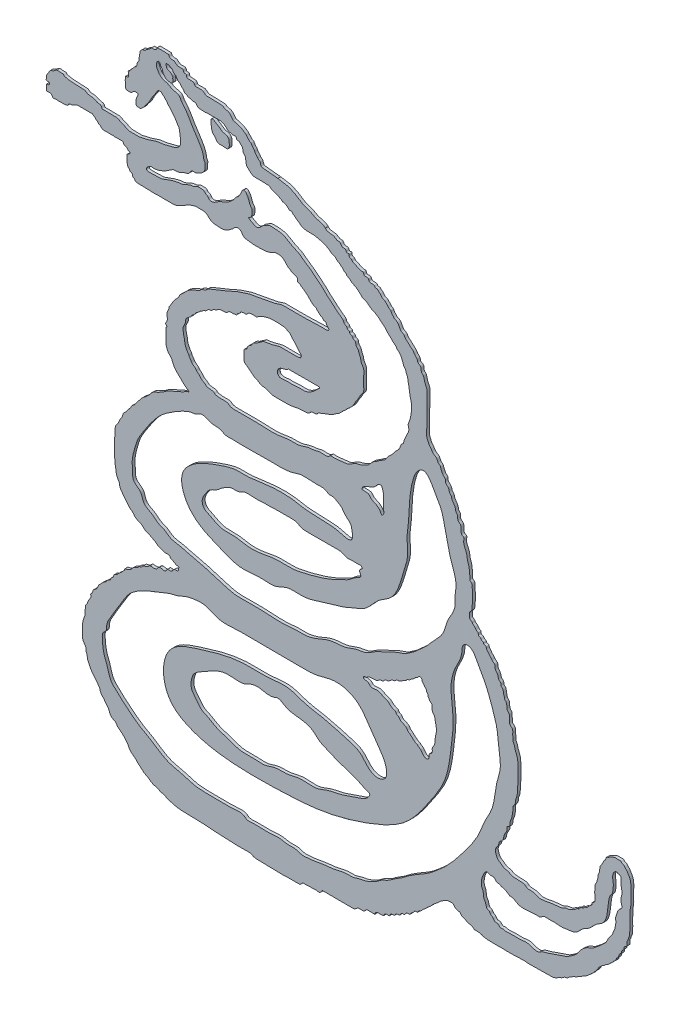
from build123d import *

# Parameters (mm, degrees)
BOSS_EXTRUDE1_DEPTH   = 1
BOSS_EXTRUDE1_2_DEPTH = 1


with BuildPart() as part:
    # Sketch2 → Boss-Extrude1 (new body)
    with BuildSketch(Plane.XY):
        with BuildLine():
            add(Edge.make_bspline(
                [(-70.74785973, 88.88248971), (-70.669423875, 88.534345012), (-70.984857819, 88.184845331), (-71.172803422, 87.582650745), (-71.408524898, 87.127271354), (-71.399459247, 86.56348853), (-71.470862094, 85.957511592), (-71.532142758, 85.250661249), (-70.985827989, 84.989138307), (-70.525796316, 84.87582358), (-69.930786523, 84.831014637), (-69.453270488, 85.257512454), (-68.972202334, 85.679907398), (-68.501436108, 86.130806872), (-68.243253091, 86.798946929), (-67.656533789, 87.37854929), (-67.093777934, 88.103884048), (-66.665717116, 88.818401385), (-66.334255283, 89.446860011), (-65.943391726, 90.074143392), (-65.674741475, 90.770120496), (-65.201888103, 91.243071132), (-64.770230334, 91.887365596), (-64.393131766, 92.560146966), (-63.964793233, 93.243501799), (-63.516642951, 93.543745725), (-63.088885023, 93.559056598), (-62.554500632, 93.585064106), (-62.284232352, 92.970460684), (-61.672284904, 92.717837621), (-61.427910328, 92.283839106), (-61.041754583, 91.90029282), (-60.591228202, 91.616245034), (-60.439553213, 91.071956856), (-59.939794286, 90.633254944), (-59.570451149, 90.191390737), (-58.935973363, 89.401566), (-58.322659116, 88.678128387), (-57.550266719, 87.679240488), (-57.10680815, 86.706773955), (-56.332276114, 85.814744073), (-56.195162575, 84.630806179), (-56.057422581, 83.523920234), (-55.864166222, 82.470683993), (-55.903444023, 81.468892431), (-56.003177322, 80.520460631), (-56.710105935, 79.846800851), (-57.616470325, 79.163104585), (-59.157494788, 78.766504524), (-60.928519239, 78.290298265), (-62.698192297, 77.987664454), (-64.083015986, 77.900313981), (-65.083533884, 77.502023805), (-66.075853683, 77.16102805), (-67.392352555, 76.727435012), (-68.896515132, 76.507530626), (-70.39635836, 76.01673338), (-71.945564854, 76.225150785), (-73.476708203, 76.026729475), (-74.797486261, 76.486936), (-75.940297481, 77.171896412), (-77.079842671, 77.418673596), (-77.797437116, 78.047542766), (-78.276644971, 78.047208241), (-78.885522585, 78.05255446), (-79.633147536, 78.014042151), (-80.612255626, 78.084752812), (-81.597306188, 78.079278885), (-82.449599226, 78.117677942), (-83.398208949, 78.044346611), (-83.440975014, 78.797069168), (-84.163681418, 79.201515601), (-84.997415388, 79.145899715), (-85.714874441, 79.681481617), (-86.861249161, 80.082564641), (-88.20723338, 79.853690068), (-89.145643847, 80.762214944), (-90.139022165, 80.774360724), (-91.209097755, 80.844044227), (-92.355665708, 80.956334909), (-93.404236473, 80.90730112), (-94.309673822, 81.014292242), (-95.179904478, 81.085673433), (-95.854908522, 81.327669289), (-96.553917323, 81.368822861), (-96.788618498, 82.02682533), (-97.512767726, 81.777464118), (-98.178961688, 81.974525742), (-98.846072752, 81.993494851), (-99.507794227, 81.768688703), (-99.977170492, 81.335389332), (-100.543948823, 80.929980041), (-101.217588323, 80.877645173), (-101.715413163, 80.353502108), (-101.907434804, 79.667429514), (-102.412094333, 79.236416864), (-102.743113415, 78.583751062), (-102.647185699, 77.92066486), (-103.034060243, 76.678348652), (-101.829759485, 77.130987261), (-101.6138082, 76.578308456), (-101.684179367, 76.187040827), (-102.119041073, 75.936844918), (-102.860017779, 76.082083984), (-102.662062573, 75.289363143), (-102.713627494, 74.764319392), (-102.697641889, 74.327368272), (-102.681296231, 73.779228974), (-102.25308051, 73.88663118), (-101.816690067, 73.847184052), (-101.279520014, 73.897163069), (-100.733254112, 73.52093344), (-100.610440844, 72.576594922), (-99.46416848, 73.085601018), (-98.618640069, 72.840699635), (-97.927470624, 72.922285967), (-97.286314806, 72.934978323), (-96.759083754, 72.944660162), (-96.288163424, 72.894471883), (-95.87400902, 72.974480698), (-95.466500428, 73.070713932), (-95.139824522, 73.310806806), (-95.026095344, 73.760724686), (-94.547366647, 74.012304249), (-94.021391313, 73.93458738), (-93.509481809, 74.215571382), (-92.981289225, 74.464667054), (-92.504113638, 74.704723922), (-92.164274211, 74.93458493), (-91.870729191, 74.883360542), (-91.605682249, 74.95921424), (-91.291815735, 74.90460491), (-90.880711599, 74.924802711), (-90.472698249, 74.914138755), (-90.081595833, 74.916928139), (-89.723537426, 74.903796769), (-89.332193323, 74.967165613), (-88.950683854, 74.906931698), (-88.572004315, 74.89539128), (-88.229920874, 74.893289342), (-87.869861879, 74.948094457), (-87.577306571, 74.913551058), (-87.266364763, 74.921986901), (-86.998045351, 74.873015933), (-86.739953624, 74.958361888), (-86.564576412, 74.77937663), (-86.296408941, 74.6433058), (-86.014620863, 74.328054187), (-85.559235433, 74.183979867), (-85.410194603, 73.600881876), (-84.71853946, 73.561289966), (-84.562508092, 72.822859001), (-83.890332815, 72.871016981), (-83.695298214, 72.398585306), (-83.284955894, 72.069698996), (-82.768392915, 71.93336375), (-82.191302658, 71.936023077), (-81.785084527, 71.957597738), (-81.232734223, 71.956481854), (-80.753067366, 71.917112612), (-80.120373217, 71.912056011), (-79.446055666, 71.987202542), (-78.63362825, 71.804441509), (-77.889662936, 72.01019845), (-77.214404046, 71.877661913), (-76.672219118, 71.867214721), (-76.074570283, 71.98415235), (-75.813906233, 71.493967378), (-75.662218494, 70.885927589), (-74.902059358, 70.939744919), (-74.486025251, 70.415921897), (-74.092250338, 70.042439749), (-73.473403719, 69.934969431), (-73.674314616, 69.139809618), (-74.45027347, 69.089608323), (-74.785236615, 68.297141082), (-74.518194189, 67.730336867), (-74.665891887, 67.069483285), (-74.572865666, 66.402690998), (-74.497369663, 65.717619888), (-74.320476131, 65.041586191), (-73.774244571, 64.740989529), (-73.610076489, 64.12446389), (-73.171500692, 63.952750068), (-72.805332092, 63.741639045), (-72.689748383, 63.359127296), (-72.612522089, 62.876839715), (-72.128807812, 62.672092261), (-71.824251039, 62.372286864), (-71.634808805, 61.911299038), (-71.00238939, 61.871155844), (-70.295220377, 61.77333466), (-69.515010524, 61.871236203), (-68.82607864, 61.781015637), (-68.222042964, 61.748124964), (-67.507635907, 61.747193358), (-66.53127378, 61.693206557), (-65.420466012, 61.625557305), (-64.248562122, 61.766724085), (-63.20924044, 61.741496956), (-62.112372379, 61.691220121), (-61.059859443, 61.687849672), (-59.9454606, 61.735616865), (-58.876095685, 61.722647905), (-57.627534263, 61.705050198), (-56.547945516, 62.24101308), (-55.548902773, 62.767217024), (-54.807074743, 63.129505772), (-53.947541321, 63.670334691), (-53.091542301, 64.280529644), (-51.879024094, 64.545315994), (-50.868381912, 65.039712801), (-49.714265839, 64.979444683), (-48.732340472, 64.933475057), (-47.841089305, 64.940357843), (-46.988326452, 64.833486971), (-46.362974766, 64.192717805), (-45.745193684, 63.623336378), (-45.121960587, 63.150856563), (-44.379326752, 62.937784266), (-43.69679805, 62.879065623), (-43.033502115, 62.867106645), (-42.467884036, 62.797865604), (-41.9533884, 62.777204285), (-40.770904339, 62.757479116), (-39.507820997, 63.181720342), (-38.338804902, 64.182191592), (-37.480068667, 64.761811342), (-36.742439705, 65.650854816), (-35.703794122, 65.912499013), (-34.830127299, 65.504636761), (-34.368910595, 64.787266879), (-33.901826727, 64.145710732), (-33.14409608, 63.853983898), (-32.190759485, 63.762234895), (-31.007071661, 63.577429077), (-29.622471215, 63.484560918), (-28.41281934, 63.530115351), (-27.401889364, 63.576533842), (-26.508590821, 63.578893172), (-25.746313443, 63.733751603), (-24.938555391, 63.915611432), (-24.163126554, 64.242208397), (-23.354170215, 64.68334916), (-22.611680913, 64.929253742), (-21.882728797, 64.87470338), (-21.037083033, 64.965119565), (-20.216489455, 64.543827791), (-19.698546241, 64.033877986), (-19.195817337, 63.700518537), (-18.873871865, 63.233054944), (-18.413272048, 62.762629912), (-18.00239613, 62.493400253), (-17.735276607, 62.462595737)],
                knots=[0, 0, 0, 0, 0.004101151, 0.005801422, 0.008297655, 0.010728028, 0.012991776, 0.016706481, 0.01835518, 0.020350503, 0.023133289, 0.025619275, 0.028369297, 0.031719091, 0.03397603, 0.037637828, 0.042393368, 0.046066124, 0.048575383, 0.051738744, 0.055801959, 0.058199769, 0.06044356, 0.06598826, 0.06834953, 0.071046866, 0.072574804, 0.074008503, 0.077665418, 0.079773584, 0.082493, 0.083907424, 0.08697537, 0.089134674, 0.090962096, 0.095563107, 0.096746797, 0.10428678, 0.108067062, 0.113289041, 0.118313154, 0.123139473, 0.128493447, 0.133153885, 0.137083716, 0.141819001, 0.144984189, 0.149537704, 0.15670607, 0.165525775, 0.173785266, 0.180313949, 0.183583947, 0.187881665, 0.194147293, 0.201755107, 0.207891107, 0.214582166, 0.221999384, 0.22788863, 0.232543465, 0.239479856, 0.243024746, 0.244268238, 0.245656683, 0.251079478, 0.254055899, 0.25861755, 0.263774631, 0.266238565, 0.269072136, 0.271471691, 0.276384766, 0.279527205, 0.282877024, 0.292291518, 0.29542512, 0.299075878, 0.304751201, 0.30977965, 0.314153963, 0.318521506, 0.321797831, 0.325500172, 0.328222712, 0.329982739, 0.333188759, 0.335954577, 0.339414746, 0.34169117, 0.344968072, 0.347744421, 0.350682176, 0.353422608, 0.356625463, 0.359815426, 0.361950663, 0.365800628, 0.369432715, 0.373748616, 0.375130252, 0.37634354, 0.378727494, 0.381024181, 0.38394439, 0.386221579, 0.38843276, 0.390096178, 0.391858492, 0.392820752, 0.396118494, 0.398588435, 0.400825737, 0.406677734, 0.409220552, 0.412790278, 0.415563939, 0.417711005, 0.419719832, 0.421755973, 0.423206269, 0.425251582, 0.426658558, 0.429069811, 0.431465243, 0.43345673, 0.436515332, 0.439192256, 0.440595489, 0.441630229, 0.44294622, 0.444151401, 0.445756303, 0.448357352, 0.449519522, 0.450903059, 0.453067509, 0.454676483, 0.455949805, 0.458054209, 0.459167883, 0.460717702, 0.461907502, 0.463236117, 0.464345017, 0.465042562, 0.466302842, 0.468328912, 0.470521461, 0.471997037, 0.475466731, 0.477452075, 0.480436463, 0.48206608, 0.483664789, 0.487241756, 0.488796238, 0.491269123, 0.49258948, 0.496061964, 0.497595281, 0.500911574, 0.504941513, 0.508299487, 0.510792191, 0.513810053, 0.515696217, 0.517914398, 0.520150591, 0.523229439, 0.525899326, 0.528521398, 0.530601486, 0.532496289, 0.536692151, 0.539236342, 0.542431983, 0.544405997, 0.547939213, 0.551173501, 0.553616977, 0.556695713, 0.558673767, 0.561407442, 0.562433447, 0.564093548, 0.566401366, 0.568394144, 0.570470978, 0.572026461, 0.574463937, 0.577789189, 0.581810075, 0.584566608, 0.586926357, 0.589764292, 0.593963958, 0.599798723, 0.604361351, 0.609449982, 0.613453549, 0.618813574, 0.623295339, 0.628112577, 0.632940815, 0.639475909, 0.643556865, 0.647882093, 0.650299531, 0.656943443, 0.661443247, 0.666506413, 0.67144356, 0.676321033, 0.679479654, 0.683261717, 0.687127261, 0.690816726, 0.694458356, 0.697232919, 0.700850619, 0.703456179, 0.705956829, 0.708340931, 0.710225161, 0.721538869, 0.724576883, 0.730486163, 0.735128334, 0.739437538, 0.743497417, 0.746867183, 0.750595829, 0.753643433, 0.757175147, 0.763221548, 0.769389316, 0.77540218, 0.779134298, 0.782714419, 0.787124775, 0.789325642, 0.793605239, 0.798110944, 0.801515862, 0.803645638, 0.807676725, 0.812511443, 0.815076179, 0.817276444, 0.820367932, 0.822389682, 0.826091912, 0.826091912, 0.826091912, 0.826091912], degree=3))
            Line((-17.735276607, 62.462595737), (-17.68340861, 62.432659884))
            add(Edge.make_bspline(
                [(-17.68340861, 62.432659884), (-17.52067252, 62.102640225), (-16.349921136, 61.635313496), (-14.674984035, 61.249473453), (-15.155915619, 59.799849692), (-14.738814292, 59.970771611), (-14.542299707, 59.656309398), (-14.156686257, 59.652554496), (-13.985792002, 59.342052406), (-13.506173702, 58.985080382), (-12.838040094, 58.74145122), (-12.233302511, 58.061623194), (-11.436254982, 57.548790508), (-10.647570028, 56.601767787), (-9.681272273, 55.632582276), (-8.590728574, 55.426701275), (-8.238066131, 54.784953514), (-7.770323407, 54.450854718), (-7.278669599, 53.747859474), (-6.373453768, 53.541579364), (-5.986087187, 52.726790845), (-5.130396538, 52.900780142), (-4.945147177, 52.030746041), (-4.528054356, 51.532695931), (-3.874990996, 50.878857426), (-4.86122471, 50.307895935), (-5.948084185, 50.522092629), (-7.386877927, 50.444651816), (-8.807186001, 50.458274382), (-10.167482052, 50.400648711), (-11.81767181, 50.262820555), (-13.633680404, 50.24462442), (-15.473843667, 50.23209572), (-17.056803989, 50.282890359), (-18.727328283, 50.201550692), (-20.533467728, 50.393580424), (-22.332757265, 49.596713488), (-24.592183556, 49.093530087), (-26.947210694, 48.677260193), (-29.437712101, 48.228427701), (-31.622813824, 47.971712895), (-33.530353173, 47.340204052), (-35.588717512, 46.627558265), (-37.319244384, 46.031648254), (-39.051581501, 45.060259823), (-40.648485325, 44.512651368), (-42.2831861, 43.735355009), (-43.989096418, 43.101241648), (-45.452417616, 42.572481297), (-46.647791202, 41.931495297), (-47.317654403, 41.107011159), (-48.4945892, 41.157160279), (-49.224417459, 40.020605155), (-50.826962466, 39.615311327), (-52.342252191, 38.863267243), (-53.803845403, 37.812966879), (-54.874362371, 36.507762094), (-56.14234194, 35.676208789), (-56.582720053, 34.330326543), (-57.384594693, 33.702836628), (-58.100443685, 32.735366824), (-58.809311369, 31.839249139), (-59.314179192, 30.736146332), (-59.915955699, 30.101445245), (-59.959589, 29.016804149), (-60.741663098, 28.147517137), (-60.645051097, 26.691185783), (-60.269515909, 25.407063475), (-61.500695313, 24.247118755), (-60.354814013, 23.54785791), (-61.061288156, 23.387308694), (-60.916262366, 22.723042268), (-61.031770461, 21.841044858), (-60.986803249, 20.674797067), (-60.992900009, 19.618529856), (-60.998871763, 18.706179128), (-60.968161568, 17.790774773), (-60.606724228, 16.865175244), (-60.213518568, 15.898881499), (-59.044506575, 15.007931333), (-58.537738379, 13.317980633), (-57.394074937, 11.543811269), (-55.884697628, 10.418914119), (-54.729415929, 9.003834263), (-53.876155697, 8.527367436), (-52.76041101, 7.677419228), (-53.706510675, 7.447813201), (-54.335375634, 7.288249488), (-54.871266062, 6.59167931), (-55.72086192, 6.418116008), (-56.515822119, 6.000104451), (-57.35233566, 5.65350232), (-58.043978901, 5.212804184), (-58.980045643, 5.059578742), (-59.741427524, 4.489948326), (-60.468747811, 4.278685918), (-60.912222042, 3.914720764), (-61.352685228, 3.657666201), (-61.910111607, 3.174299177), (-62.744048457, 2.815376903), (-63.62387019, 2.116498474), (-64.599083593, 1.852811774), (-65.500248435, 1.356209739), (-66.186000373, 0.7949075), (-66.660346976, -0.080148477), (-67.409566055, -0.575598646), (-67.935728571, -1.340288451), (-68.78524791, -1.678216997), (-69.239248697, -2.340783014), (-69.852132802, -2.762099818), (-70.071064364, -3.346449819), (-70.425376569, -3.681184669), (-70.859278676, -4.045444895), (-71.196821501, -4.571925338), (-71.601482497, -5.337465048), (-72.204795403, -5.903344009), (-73.113656886, -6.494521128), (-73.296631642, -7.504667213), (-74.214706369, -8.08520824), (-74.572566212, -8.866092021), (-75.131534372, -9.554737404), (-75.695735125, -9.932279789), (-76.079899959, -10.667806884), (-76.24778171, -11.64753789), (-77.112511774, -12.583111292), (-77.414626532, -13.695081629), (-77.973144682, -14.614573615), (-78.759071576, -15.399074198), (-78.716644627, -16.462379619), (-78.84174121, -17.318429415), (-78.852490979, -18.307758668), (-78.917641601, -19.519924598), (-78.954075284, -21.194554976), (-79.0045106, -22.629783394), (-79.036817153, -24.100943115), (-79.058070244, -25.071649728), (-78.739565355, -25.881715767), (-78.916335365, -26.724125319), (-78.498278623, -27.833436927), (-78.506268488, -29.301868233), (-78.11434063, -30.423708898), (-77.722074082, -31.239192249), (-77.189021408, -31.871576912), (-77.26581076, -32.972802523), (-76.701886432, -33.906839905), (-76.13702178, -34.55608156), (-75.850087518, -35.179696155), (-75.290960124, -35.669419313), (-74.761934098, -36.315640362), (-74.297497881, -37.084271601), (-73.669711455, -37.781156961), (-72.81567015, -38.275894513), (-72.229003223, -38.886585229), (-71.895949137, -39.58861296), (-71.282212876, -39.764541597), (-70.747596155, -40.294987769), (-69.737210558, -40.471641162), (-68.983924859, -41.140383082), (-68.32805598, -41.830454679), (-67.530332569, -42.074040215), (-66.61195741, -42.435873354), (-65.660197209, -43.078879783), (-64.722368812, -43.419620361), (-63.957725045, -44.26132505), (-62.763607879, -44.395401734), (-61.529981889, -45.444547009), (-59.82009424, -44.747187442), (-59.374205147, -46.048467985), (-58.178150569, -46.239065755), (-57.642974323, -46.900514707), (-56.101574443, -47.101234623), (-56.643363251, -47.427601049), (-56.563331625, -47.630067452), (-56.576507591, -47.942155436), (-56.864794122, -48.7024557), (-58.01523166, -48.277877991), (-58.601556235, -49.221962023), (-59.383304002, -49.902562702), (-60.54888643, -49.472124742), (-60.853409707, -50.409659617), (-61.852315494, -50.889395445), (-62.829529019, -50.270887186), (-63.800100574, -50.790856214), (-64.090519133, -51.490987084), (-64.783496658, -51.696797492), (-65.55991745, -51.814881299), (-66.544013547, -51.439693726), (-67.262217186, -52.361844492), (-68.075612871, -52.729042788), (-69.049038045, -52.792905419), (-69.410530071, -53.645957096), (-70.468565837, -53.71113541), (-71.119294177, -54.789715553), (-72.237445916, -54.893645394), (-72.764209828, -55.618320652), (-73.167838124, -56.055120899), (-73.793981275, -56.566406356), (-74.537850585, -56.841802414), (-75.212438356, -56.861037807), (-75.467810406, -57.104783373), (-75.396885839, -57.440664896), (-75.808784638, -57.855290384), (-76.303837501, -58.388344567), (-76.954763481, -59.016223856), (-77.64906072, -59.559795879), (-78.231537065, -60.36916254), (-79.297958931, -60.539051548), (-79.219915661, -61.283268715), (-79.510694552, -61.726282262), (-80.192866019, -62.052806309), (-80.320918726, -63.052339224), (-81.2968656, -63.235187986), (-81.799650436, -64.270704401), (-82.92181955, -64.716659668), (-83.653436483, -65.724393965), (-84.423536431, -66.293474253), (-84.82931733, -67.31794139), (-85.351412868, -68.27290872), (-86.620485368, -68.835901285), (-86.548670163, -70.019274931), (-87.408702863, -70.573049893), (-87.142202468, -71.157023856), (-87.251151916, -71.667708466), (-87.723962396, -72.368615285), (-88.237088725, -73.154052838), (-88.48273092, -74.195814851), (-89.256666377, -74.805229906), (-89.05435831, -75.807775271), (-89.372633759, -76.631254787), (-89.12004398, -77.624090526), (-89.517187069, -78.757539096), (-89.973528485, -79.876999928), (-90.124786454, -80.957943853), (-90.089985317, -82.182347176), (-90.045288869, -83.666338699), (-90.286045173, -85.416320395), (-89.55938187, -86.698361031), (-88.783793195, -87.643484272), (-89.048553289, -88.589118701), (-88.418332677, -89.479467417), (-88.599766149, -90.746586321), (-87.85119259, -91.986625744), (-87.351935545, -93.200063395), (-86.55113437, -94.366290736), (-85.56418054, -95.38031902), (-84.859110252, -96.521167709), (-84.084513789, -97.415340828), (-83.989964215, -98.272713625), (-83.68309424, -98.836294512), (-83.25361049, -99.390675245), (-82.546197406, -100.057195727), (-81.912990937, -101.262014205), (-80.914015539, -102.148861467), (-80.634589309, -103.425638876), (-79.873093596, -104.467635387), (-78.733482546, -104.747946513), (-78.221324496, -105.507836773), (-77.852215079, -106.071542426), (-77.220737835, -106.561074497), (-76.552327454, -107.098815561), (-75.772102082, -107.690217445), (-75.123652749, -108.650696003), (-74.2437895, -109.496593358), (-73.81813382, -110.822642308), (-72.757126023, -111.718555871), (-71.73131804, -112.422191368), (-70.940153106, -113.446002953), (-69.789739717, -114.199757532), (-68.732468273, -115.415217338), (-67.389738508, -115.941840243), (-66.40252883, -116.744906968), (-65.342401782, -117.339360645), (-64.079416762, -117.562710139), (-62.880404709, -118.250555935), (-61.501518181, -118.522471234), (-60.402355925, -119.146889233), (-59.224276825, -119.472129664), (-57.799972651, -119.921375613), (-55.870076828, -120.254797855), (-53.950430231, -120.186411447), (-52.22026358, -120.227764341), (-50.878935286, -120.298871141), (-48.529377159, -120.382359499), (-46.159191887, -120.471664474), (-43.713302723, -120.75587369), (-42.137116391, -120.699475812), (-40.979309587, -120.854695058), (-39.729475453, -120.955198624), (-38.767522573, -120.965363347), (-37.287812565, -120.991176511), (-35.688206401, -121.122351464), (-33.947846253, -121.048155092), (-32.510136366, -121.048440344), (-31.433824348, -121.015543387), (-30.517892468, -121.60840536), (-29.476154374, -121.791813269), (-28.37664358, -121.819290869), (-27.435850775, -121.853737902), (-26.397037129, -121.769519724), (-25.396299403, -121.936442836), (-24.040712794, -121.848271669), (-22.712522563, -121.918906757), (-21.142001817, -121.977616847), (-19.907274919, -121.976778164), (-18.815948795, -121.943954037), (-17.723931932, -121.839316664), (-16.640490576, -121.932823203), (-15.493571872, -121.894386994), (-14.749126942, -121.904550116), (-13.843166965, -121.858668947), (-13.573170766, -121.013263972), (-12.823457567, -120.869947935), (-12.146580557, -120.978373245), (-11.452006403, -120.825821414), (-10.757180422, -120.835941091), (-10.038662224, -120.865117799), (-9.262049677, -120.769260322), (-8.281414009, -120.74436074), (-7.386857222, -121.054986355), (-6.854631514, -120.500181728), (-6.579928827, -120.174490147), (-6.428881399, -119.794215763), (-6.187467528, -119.797130423), (-5.982826421, -119.845085538), (-5.701289542, -119.77312859), (-5.436150853, -119.813705842), (-5.205351944, -119.793815261), (-5.001211006, -119.787567961), (-4.741679233, -119.777324956), (-4.40265447, -119.813794441), (-4.003182846, -119.806398505), (-3.590203114, -119.815954383), (-3.218438352, -119.809364608), (-2.929585674, -119.843788682), (-2.586111361, -119.794104258), (-2.257580839, -119.818380396), (-1.742420522, -119.852159963), (-1.305520695, -119.84301317), (-0.844816949, -119.835891626), (-0.492855543, -119.838024215), (-0.125007904, -119.816249678), (0.294920834, -119.836108372), (0.677866229, -119.862931481), (1.026956562, -119.838456144), (1.325690577, -119.838437962), (1.631527982, -119.826536336), (1.91086084, -119.833085313), (2.178711921, -119.804538629), (2.468878097, -119.851175908), (2.795701537, -119.852181095), (3.101430431, -119.85845912), (3.374085813, -119.831905089), (3.709623299, -119.84948675), (4.008376534, -119.827619627), (4.339658622, -119.84592422), (4.615596288, -119.850886406), (4.932304695, -119.831466621), (5.12599158, -119.586134371), (5.394600756, -119.422667501), (5.649951379, -119.16922636), (5.894659458, -118.991452908), (6.10854841, -118.914909913), (6.27251137, -118.83309849), (6.467858656, -118.843203407), (6.684707106, -118.837197452), (6.8851719, -118.850615157), (7.076548645, -118.812267219), (7.261479688, -118.807983737), (7.447808575, -118.819468016), (7.630182888, -118.840666656), (7.825010849, -118.837114805), (8.075453244, -118.774225431), (8.36953471, -118.657320729), (8.538961131, -118.415745993), (8.729161473, -118.203717748), (8.890977007, -118.015619608), (9.128718627, -117.846280438), (9.347369913, -117.845873729), (9.58717888, -117.834015929), (9.811217041, -117.848726019), (10.073283434, -117.8102411), (10.299669815, -117.829981287), (10.514755039, -117.817746359), (10.704334517, -117.821830668), (10.93059404, -117.815759882), (11.137954054, -117.840405834), (11.398725497, -117.82202428), (11.616068439, -117.774839959), (11.977495018, -117.91101105), (11.961178148, -117.693682238), (12.026410389, -117.551759686), (12.111843619, -117.368934126), (12.253898484, -117.184395895), (12.445994727, -117.032452489), (12.635083536, -116.870209877), (12.864191626, -116.84945403), (13.070200079, -116.860902189), (13.36493514, -116.811789352), (13.663245966, -116.888900171), (13.951418799, -116.822523211), (14.189317017, -116.813912524), (14.437003558, -116.788516002), (14.678480067, -116.793920234), (14.919969416, -116.841933898), (15.062679732, -116.645302648), (15.152681819, -116.441281085), (15.168269941, -116.20590885), (15.373106273, -116.056007529), (15.591929435, -115.947507268), (15.831849946, -115.82136468), (16.136838952, -115.810874965), (16.44774741, -115.792874625), (16.722806072, -115.823096634), (17.04598881, -115.799444402), (17.199068174, -115.510774853), (17.228672866, -115.231040186), (17.415809834, -115.095835204), (17.576637349, -114.975182703), (17.797918349, -114.857110483), (18.051558562, -114.808763564), (18.288338551, -114.809824776), (18.58732918, -114.819513141), (18.908583685, -114.682680436), (19.041432757, -114.366875239), (19.175462368, -114.129619905), (19.381394794, -114.017319788), (19.606189163, -113.96875074), (19.767765792, -113.896803677), (19.887892609, -113.840418241), (20.046478109, -113.822124166), (20.275353296, -113.889130573), (20.55332454, -113.736233769), (20.749472117, -113.606058377), (20.88633955, -113.479257148), (20.978493152, -113.295709886), (20.991138531, -113.079843593), (21.183239326, -112.874224115), (21.454817837, -112.855358217), (21.749691895, -112.768000726), (21.993935386, -112.825383246), (22.242989387, -112.758462348), (22.410302873, -112.618538521), (22.548034354, -112.429246704), (22.655757946, -112.28666456), (22.785640549, -112.147186096), (22.900045823, -112.047170548), (22.960383864, -111.908426986), (23.139079323, -111.873240044), (23.374176227, -111.814119915), (23.651543236, -111.826644348), (23.924289738, -111.812140071), (24.150567245, -111.810683624), (24.236429611, -111.673090968), (24.296174043, -111.5686967), (24.329153338, -111.398374401), (24.487663346, -111.255205055), (24.656849934, -111.127613706), (24.778991431, -110.961406197), (24.925886282, -110.866727103), (25.030867261, -110.801606551), (25.103598613, -110.721204988), (25.267316592, -110.637191562), (25.430496874, -110.463795887), (25.600426498, -110.229223946), (25.755826702, -110.037688747), (25.899605, -109.797787314), (26.199775037, -109.820407573), (26.47527744, -109.795352749), (26.748422206, -109.828234175), (26.962865642, -109.738238428), (26.988706021, -109.541586073), (27.062286682, -109.295286638), (27.402791764, -109.222244658), (27.534727345, -108.954153772), (27.744656103, -108.865472392), (27.884586373, -108.800052822), (28.016804521, -108.741889362), (28.09020641, -108.659637238), (28.150881164, -108.58848633), (28.253767834, -108.526192077), (28.397650904, -108.310872083), (28.602268966, -108.096340586), (28.838447124, -107.92415276), (28.945259285, -107.787023424), (29.069460956, -107.652508509), (29.231313547, -107.519947808), (29.449040914, -107.428385891), (29.586550408, -107.276916062), (29.731510225, -107.158600348), (30.012559278, -106.918860645), (30.239983241, -106.602042447), (30.571339467, -106.329908027), (30.781982058, -106.18145066), (31.196333208, -105.830917675), (31.767358101, -105.295869011), (32.408735321, -104.498514762), (33.21389224, -103.860523155), (34.057309136, -103.226257508), (34.814852887, -102.401813366), (35.688430678, -101.894943398), (36.427612254, -101.426595397), (37.014068679, -101.042961762), (37.726744756, -100.899764296), (38.390292771, -100.987176086), (39.285928968, -100.78806672), (39.775198668, -101.709452302), (40.620703952, -102.319730519), (41.775752997, -102.237422077), (42.101128163, -103.180463756), (42.967825953, -103.446198056), (43.779610546, -103.783552864), (44.727706373, -104.290800997), (45.582764397, -104.269829794), (46.235107459, -104.605142782), (46.636186002, -105.184093681), (47.520171136, -105.067133959), (48.323308203, -105.132089264), (48.975272224, -105.233684214), (49.515266861, -105.459185933), (50.107289707, -105.715171778), (50.882867595, -105.778643756), (51.6385515, -105.889049539), (52.485397848, -105.833638375), (53.335865328, -105.853075571), (54.229707318, -105.920617714), (54.947924935, -105.924385636), (55.560945404, -105.873207898), (56.083623381, -105.884451465), (56.820422571, -105.878748798), (57.504868452, -105.898740745), (58.608755235, -105.973610493), (59.55807941, -105.939622834), (60.650465946, -105.935572308), (61.466729864, -105.828848058), (62.375485786, -105.872326164), (63.440879676, -105.810342382), (64.349769771, -105.74286542), (65.269026512, -105.9356375), (66.111057457, -105.914567457), (67.114795504, -105.920656546), (67.949305383, -105.919882264), (68.797579428, -105.918308057), (69.710384049, -105.929185658), (70.679377838, -105.88639907), (71.750845506, -105.921702477), (72.709113125, -105.7817619), (73.781856954, -105.847521254), (74.656258459, -105.66673757), (75.576050925, -105.363809917), (76.123295108, -104.679531697), (77.290049842, -104.577718543), (77.990616568, -103.58369279), (79.23186266, -103.616336746), (79.770188054, -102.841686929), (80.692242469, -102.519538328), (81.295483254, -101.864665773), (82.224873454, -101.717101704), (82.841794893, -101.180235883), (83.666939431, -100.833881007), (84.452742585, -100.27180227), (85.386350787, -99.787283244), (86.156789038, -99.288972762), (86.646084046, -98.747926202), (87.210227432, -98.476746911), (87.480185521, -97.865263199), (88.223862896, -97.607363698), (88.497648463, -96.848878294), (89.234113477, -96.376530441), (89.499153796, -95.836262701), (89.868895023, -95.386092122), (90.039774625, -95.003064473), (90.39093965, -94.525237089), (90.817539319, -94.119617061), (91.322447819, -93.635071612), (91.98461703, -93.365360628), (92.389915839, -92.806036408), (93.05636502, -92.570872719), (93.592352997, -92.194705706), (94.002312221, -91.585314223), (94.483019926, -91.27959279), (94.854571174, -90.919805881), (95.12851027, -90.653700736), (95.372792971, -90.254341478), (95.769029023, -90.042241913), (96.127875682, -89.653247586), (96.230632079, -89.164384387), (96.487829126, -88.701911543), (96.921696305, -88.482549554), (97.104031218, -88.036714767), (97.155681897, -87.61400606), (97.361160725, -87.187522624), (97.644599889, -86.860144437), (98.155581337, -86.636810829), (97.949071594, -86.099788285), (98.265439361, -85.675573656), (98.512190237, -85.28239415), (98.914815082, -85.055833702), (98.937215542, -84.733000533), (98.97280199, -84.402669573), (99.103560119, -84.004738169), (99.482506393, -83.718833479), (99.898427551, -83.579875233), (100.054597672, -83.207278693), (100.017755485, -82.832947395), (100.080870394, -82.441115988), (99.998716292, -81.956585646), (100.349812194, -81.447613431), (100.44960175, -80.778050265), (100.813913552, -80.146200155), (100.938951333, -79.277336305), (100.930012553, -78.438365798), (101.022199754, -77.634740887), (101.019985313, -76.987157821), (100.956991419, -76.414717188), (100.955471096, -75.883901022), (100.994630911, -75.463210162), (100.974680483, -74.530237178), (100.997173456, -73.56331822), (100.997200447, -72.368143189), (101.111963789, -71.592539477), (101.325052754, -70.699338385), (101.353333567, -69.882471254), (101.37615194, -69.028681823), (101.328278466, -68.339857191), (101.335258373, -67.830742593), (101.330565499, -66.716734655), (101.4109935, -65.528157376), (101.339501727, -64.035676405), (101.234398047, -63.158102991), (100.924733602, -62.187634936), (100.385543869, -61.505931724), (100.000257848, -60.595728366), (99.317554699, -60.147270783), (98.925765875, -59.425223037), (98.189293498, -59.375956625), (97.805175959, -58.65136359), (97.119334652, -58.796945302), (96.450960078, -58.783252329), (95.71087588, -58.653272975), (94.96939564, -59.122220501), (94.228906208, -59.324034463), (93.578725276, -59.865395641), (92.675346776, -60.056078042), (92.641909704, -60.934888486), (92.102712698, -61.435813852), (91.703600824, -62.06259336), (91.426035209, -62.839936209), (90.796007077, -63.494623656), (90.464590148, -64.396600144), (90.485678004, -65.360341767), (90.294979274, -66.171740474), (89.801070061, -66.877895368), (89.907491164, -67.783265508), (89.603491711, -68.565955639), (89.43521863, -69.511239561), (88.778579688, -70.272872418), (88.844778174, -71.544813669), (88.632001007, -72.733029044), (88.849482934, -73.95204326), (88.782001183, -74.839643964), (88.858020497, -75.575858565), (88.389204308, -76.069969693), (87.725463991, -76.297127631), (87.840988878, -76.940490054), (87.463137104, -77.430624366), (86.622817992, -77.851030624), (86.262364684, -78.832401318), (85.155639008, -78.900468514), (84.827349567, -79.700968358), (84.070085798, -79.66307359), (83.60278572, -80.074230926), (83.313312386, -80.664196481), (82.463055872, -80.684395939), (82.080664186, -81.426306824), (81.112429934, -81.627810068), (80.43269352, -82.369882761), (79.350478665, -82.528515306), (78.243393795, -82.609690273), (77.248231007, -83.408147145), (75.732636414, -83.379279229), (74.259017802, -83.602756654), (72.882043507, -83.762363579), (71.667844943, -84.112437771), (70.507974625, -84.21129363), (69.263567282, -84.318789049), (68.339902805, -83.729029215), (67.297116124, -83.493667548), (66.261758249, -83.374321866), (65.014781663, -83.505449478), (64.282382523, -82.466415262), (62.820877187, -82.519403404), (61.384044253, -82.414260446), (59.69473595, -82.350934907), (58.557927357, -81.527624521), (57.000902725, -81.3548089), (55.892840814, -80.42695877), (54.643157217, -79.580660002), (54.156008469, -78.358667954), (53.869934754, -77.115488278), (54.557256356, -76.121232436), (55.28133427, -75.221638562), (55.306820411, -73.889606854), (56.424251254, -73.474295016), (56.91722086, -72.476615143), (57.00681457, -71.360808402), (57.59049183, -70.302621959), (58.264686275, -69.37947354), (57.868161171, -67.980667973), (59.009745205, -67.886347875), (59.075126413, -67.250686729), (59.103698077, -66.765105242), (59.232932867, -66.014200029), (59.532560843, -65.296528787), (59.884924972, -64.428380794), (59.892017784, -63.547018085), (60.120405967, -62.770539168), (60.15886352, -61.990207994), (60.020608154, -61.128311734), (60.738918739, -60.385274691), (61.123381323, -59.469685642), (61.05894375, -58.414931433), (61.684813543, -57.284393086), (61.707339208, -55.651990827), (61.833140319, -53.716636464), (61.996991138, -51.919910353), (62.000527973, -50.283355689), (62.020948951, -48.74054864), (61.928248567, -47.191416089), (61.771110303, -45.79988129), (61.375228145, -44.736143274), (60.974669606, -43.86876885), (60.823090762, -43.010960528), (60.622184481, -42.244097819), (60.08937351, -41.49529178), (60.350794354, -40.534947811), (60.063501641, -39.761894221), (60.092402777, -39.0472003), (60.133357406, -38.426679717), (59.991797691, -37.684238593), (59.431868788, -37.242175346), (58.977255875, -36.788653251), (58.924132162, -36.09007115), (58.915239897, -35.302064035), (58.901389121, -34.46890512), (58.89517108, -33.684204676), (58.301158621, -33.266327906), (58.060323052, -32.623446613), (58.022546882, -31.849149278), (58.01444571, -31.126669087), (57.669472631, -30.474789672), (57.121858327, -30.116372538), (57.200777684, -29.505030113), (56.963824415, -29.015519136), (56.929198923, -28.581222872), (56.801094861, -28.007721998), (56.73490372, -27.267615587), (55.8269923, -26.795739618), (56.121151587, -25.774149914), (55.299379189, -25.463353147), (55.011520549, -24.691696984), (54.902973738, -24.054178559), (54.457656811, -23.290159262), (53.772169463, -22.625686119), (54.115536436, -21.230347261), (52.917201987, -20.821802602), (52.524923043, -19.859990667), (51.754831784, -19.369597751), (51.413693529, -18.546679565), (50.834051207, -18.124750368), (50.901440121, -17.263883858), (49.894451835, -17.344064752), (49.904295669, -16.474581939), (49.289977868, -16.438753027), (48.979332219, -16.016299979), (48.71497287, -15.613922934), (47.906872203, -15.544143853), (48.22620352, -14.564851486), (47.330660227, -14.344435926), (47.06754645, -13.710775151), (46.577710313, -13.238125494), (46.037018759, -12.911319773), (45.760638983, -12.226880197), (44.925530451, -11.91485052), (45.052800914, -10.951288546), (44.863842101, -10.180942902), (45.233225211, -9.609562696), (45.708359879, -9.263008331), (45.91373865, -8.347418557), (45.886452627, -7.191004989), (46.138855858, -5.855719977), (45.966583187, -4.521229906), (46.000189799, -3.295970131), (45.903012806, -2.198733794), (46.020747536, -1.289375052), (45.684889997, -0.549686802), (45.05377114, -0.282549394), (45.143799631, 0.380350221), (45.094592985, 1.254077562), (44.954927204, 2.518436408), (44.869866119, 4.003638933), (44.14373866, 5.421549974), (44.135656557, 7.085606033), (43.360781889, 8.738553654), (42.738264284, 10.158703445), (43.248294082, 11.765699193), (42.241692495, 11.997590634), (42.026435442, 12.913718119), (42.019410752, 13.880513159), (42.04451752, 15.116325457), (40.592360747, 15.705715133), (41.122146886, 17.187856906), (40.066467094, 18.075770437), (40.111868669, 19.220348465), (39.406326124, 20.231197178), (38.767992915, 21.028540696), (38.661090638, 22.150568616), (37.804457735, 22.77162702), (37.822112041, 24.225370106), (36.278123273, 24.850533764), (36.719960935, 26.235441987), (35.656700451, 26.829857338), (35.357095592, 27.729085373), (34.951101158, 28.467975471), (34.876131572, 29.231299743), (33.89994734, 29.668047367), (33.753934149, 30.744595419), (32.979839502, 31.294032149), (32.38299578, 31.64718183), (31.866993011, 32.217814907), (31.569911741, 32.941673975), (30.788053658, 33.685790635), (30.448095116, 34.632510805), (29.967570594, 35.727557565), (30.15226159, 37.069829146), (30.07705236, 38.657255584), (30.0910283, 40.359864183), (30.107189476, 41.959109026), (30.035323835, 43.441230229), (30.274525693, 44.920435619), (30.206928935, 46.391250111), (30.200247566, 48.14726818), (30.327481301, 49.931753951), (29.480790888, 51.405408897), (29.122602212, 52.632724361), (28.943799268, 53.622341097), (28.362533934, 53.996189142), (27.984425859, 54.697598265), (28.271524904, 55.980612075), (26.796313982, 56.313680876), (26.861193253, 57.550722335), (25.827593732, 58.190525915), (25.481609845, 59.184316825), (24.650478508, 59.74268452), (24.06735581, 60.37483673), (23.294287226, 61.049025996), (22.516644064, 61.632845361), (22.160174142, 62.636260366), (21.046304409, 62.945158493), (20.450425481, 64.202828625), (19.838129733, 65.385463427), (18.662121211, 65.657396382), (18.418541314, 66.30444125), (17.686154046, 66.67227329), (17.658871658, 67.5825377), (16.804839344, 67.89636384), (16.405311263, 68.556642658), (15.816844759, 68.994297696), (15.375359936, 69.563464029), (14.730829158, 69.681857086), (14.189927466, 70.184440955), (13.812954996, 70.858223298), (13.188703699, 71.194218425), (12.799822542, 71.812255567), (12.078670007, 71.519145268), (11.816458771, 72.272616891), (11.0816251, 72.405280604), (10.493524285, 72.296237996), (9.831519626, 72.540508001), (9.791848371, 73.328934288), (9.017384309, 73.509302781), (8.354055649, 73.312171287), (8.020474458, 73.872047843), (7.815797624, 74.505588685), (7.104977094, 74.2879164), (6.602412046, 74.553159132), (5.770236012, 74.825646607), (5.073914699, 75.335329582), (4.011344215, 75.532794884), (3.827946315, 76.418012047), (2.779660663, 76.384343798), (3.108364891, 77.688825054), (2.122771117, 77.185346077), (1.898822247, 77.862821155), (1.468533373, 78.324383416), (0.825676726, 78.135147373), (0.312102108, 78.489740157), (0.019722148, 78.903786923), (-0.279969885, 79.384858915), (-0.903161292, 79.299355763), (-1.468844759, 79.520993062), (-2.01384969, 79.814123394), (-2.444941386, 80.262367155), (-3.134227794, 80.117670517), (-3.774386055, 80.423048619), (-4.461902394, 80.349862849), (-4.912324877, 80.696132275), (-5.150778215, 80.692145379), (-5.318662149, 80.951902133), (-5.345254575, 80.995995625)],
                knots=[4.3343e-05, 4.3343e-05, 4.3343e-05, 4.3343e-05, 0.001687442, 0.004575645, 0.00518474, 0.005500879, 0.005843229, 0.006474746, 0.006821343, 0.007178239, 0.008858999, 0.009576103, 0.010784867, 0.012624418, 0.014488467, 0.016220296, 0.016549584, 0.017360285, 0.018487437, 0.019874358, 0.020806137, 0.021597046, 0.022641559, 0.023597278, 0.024563195, 0.025365224, 0.027108539, 0.029158786, 0.031045827, 0.032825398, 0.034609556, 0.037685118, 0.040100116, 0.041990974, 0.044024946, 0.046829625, 0.049081195, 0.051762433, 0.056115582, 0.058663508, 0.061913424, 0.064906171, 0.066686733, 0.070658158, 0.072207994, 0.074630066, 0.077403508, 0.079458458, 0.081926758, 0.083627221, 0.084891479, 0.085882699, 0.087943558, 0.089608122, 0.092362352, 0.094723828, 0.096739075, 0.099135316, 0.100522909, 0.102193902, 0.103090482, 0.105353469, 0.106731653, 0.107968287, 0.108665111, 0.110946867, 0.112193694, 0.114345081, 0.116122058, 0.116916021, 0.117517133, 0.117832414, 0.119360314, 0.121227748, 0.122440368, 0.123604483, 0.124894523, 0.126064756, 0.127573988, 0.128986999, 0.131756243, 0.134391785, 0.137303478, 0.13937796, 0.141218297, 0.142306096, 0.142796905, 0.144328074, 0.145113176, 0.146104303, 0.147668151, 0.148728719, 0.149728978, 0.150923052, 0.152438948, 0.153462939, 0.153897089, 0.154722528, 0.155505108, 0.156834985, 0.158326218, 0.159951936, 0.160814161, 0.162450268, 0.163415054, 0.164735099, 0.165967687, 0.167037352, 0.168248309, 0.16910688, 0.169938157, 0.170654484, 0.171034136, 0.172208334, 0.173119214, 0.174496745, 0.175479558, 0.177363775, 0.178107203, 0.179697964, 0.180690012, 0.181648569, 0.182352357, 0.183948031, 0.185541211, 0.187279991, 0.188479079, 0.189856792, 0.191518734, 0.192470281, 0.19335691, 0.195470763, 0.197343211, 0.200071702, 0.201221762, 0.203260199, 0.203895763, 0.20462886, 0.206594146, 0.208481756, 0.21047061, 0.211278408, 0.212117722, 0.213680325, 0.215385064, 0.216344382, 0.217133918, 0.218091545, 0.219281591, 0.220475103, 0.221689245, 0.222991081, 0.22439976, 0.22504216, 0.225978938, 0.226766433, 0.228005063, 0.229904182, 0.23069547, 0.231775593, 0.233160544, 0.234661488, 0.236364022, 0.237062885, 0.239115757, 0.240823175, 0.243353732, 0.244153531, 0.245685795, 0.24741006, 0.248567137, 0.248953346, 0.249067849, 0.249386826, 0.250221433, 0.251798192, 0.252803324, 0.254328347, 0.255654127, 0.256591295, 0.257646368, 0.25968834, 0.260448003, 0.261774257, 0.262447147, 0.26321011, 0.264987507, 0.26588391, 0.26751981, 0.268555764, 0.269439495, 0.27077858, 0.27224777, 0.274068638, 0.274721707, 0.27575405, 0.276466051, 0.277936313, 0.278886099, 0.279009636, 0.279276902, 0.280099521, 0.281107125, 0.282296029, 0.28369627, 0.284602206, 0.286342906, 0.286717486, 0.287396295, 0.288319308, 0.289608804, 0.290756126, 0.291741824, 0.293963428, 0.295260827, 0.296691494, 0.297675219, 0.299618853, 0.300933362, 0.302693741, 0.303655307, 0.304263399, 0.304952343, 0.305674238, 0.307637849, 0.308676504, 0.309884831, 0.311165038, 0.312372215, 0.313333842, 0.315122574, 0.317010361, 0.318209587, 0.319457824, 0.321911588, 0.324217534, 0.32625552, 0.327695899, 0.328789745, 0.329801825, 0.331800367, 0.333550407, 0.335447316, 0.337080145, 0.339180274, 0.341088574, 0.342475828, 0.343792697, 0.344418994, 0.345027238, 0.346601247, 0.348274431, 0.350451051, 0.351706181, 0.353420087, 0.35533258, 0.356032646, 0.357024291, 0.358026484, 0.359199201, 0.360483044, 0.361911318, 0.363816452, 0.365284531, 0.367333794, 0.369200137, 0.370271144, 0.37246711, 0.374660941, 0.376606923, 0.378120155, 0.379754257, 0.381413264, 0.383197509, 0.385227403, 0.386978314, 0.388214273, 0.390112157, 0.39297204, 0.396005092, 0.397794095, 0.399911346, 0.401389695, 0.407220495, 0.409417426, 0.411245844, 0.413525336, 0.41408875, 0.416272842, 0.417379145, 0.420021886, 0.422704786, 0.424327679, 0.425848299, 0.426853504, 0.428597607, 0.430000386, 0.431276372, 0.432366932, 0.434165998, 0.435304625, 0.437799899, 0.43949286, 0.441606564, 0.442748196, 0.443870436, 0.445995686, 0.447098747, 0.448443796, 0.449060681, 0.450516414, 0.451220837, 0.451922762, 0.453267346, 0.454009927, 0.454707401, 0.456150562, 0.457112739, 0.458720994, 0.459361831, 0.459975245, 0.460561445, 0.460658502, 0.46091354, 0.461402184, 0.461781713, 0.461978697, 0.462328708, 0.462601295, 0.463018609, 0.46369232, 0.464201427, 0.46467454, 0.465183855, 0.465356536, 0.4660619, 0.466494729, 0.467428497, 0.467810977, 0.468342454, 0.468839363, 0.469286628, 0.470027105, 0.470375104, 0.470688056, 0.471224568, 0.471602081, 0.471807086, 0.472301075, 0.472769185, 0.4731176, 0.473526229, 0.473864726, 0.474462092, 0.47472608, 0.475189002, 0.475595076, 0.475905114, 0.476384003, 0.47685317, 0.47734462, 0.477576642, 0.477764269, 0.47806854, 0.478337318, 0.478640937, 0.4788669, 0.479115967, 0.47938019, 0.479614971, 0.479852256, 0.480155262, 0.480651784, 0.481070677, 0.481310206, 0.481796653, 0.482067832, 0.482445019, 0.48263819, 0.48303641, 0.483339056, 0.483695092, 0.483942545, 0.484201991, 0.484455404, 0.484848008, 0.485041462, 0.485482083, 0.485874316, 0.48602025, 0.486211051, 0.486515974, 0.486821314, 0.487133493, 0.487503321, 0.487784064, 0.48802541, 0.48833407, 0.488970348, 0.4892133, 0.489508442, 0.489925246, 0.490202715, 0.490496906, 0.490819783, 0.491050132, 0.491416163, 0.491689363, 0.492008342, 0.492414227, 0.492749132, 0.493216738, 0.49366117, 0.49386776, 0.494468969, 0.494738087, 0.494962328, 0.49534281, 0.495562167, 0.495958106, 0.496361867, 0.496509444, 0.497162536, 0.497574636, 0.4978584, 0.498238554, 0.498464253, 0.498781847, 0.498946949, 0.498988607, 0.499419748, 0.499843296, 0.500190651, 0.500376428, 0.500581455, 0.500999609, 0.501203111, 0.501649033, 0.502031104, 0.502430853, 0.502612472, 0.503047941, 0.503267745, 0.503553922, 0.503762966, 0.504030925, 0.504161747, 0.504331612, 0.504701379, 0.505166038, 0.505408985, 0.505837116, 0.505922042, 0.506044076, 0.506321919, 0.50658826, 0.506870216, 0.507176456, 0.507399062, 0.507566155, 0.507669344, 0.507829209, 0.508294373, 0.508606492, 0.50898543, 0.509314719, 0.509612598, 0.510088043, 0.510446378, 0.510733526, 0.510868889, 0.511214865, 0.51168295, 0.512084719, 0.512324168, 0.512570937, 0.512711862, 0.512895372, 0.513005145, 0.513084865, 0.513372236, 0.514019632, 0.514272554, 0.514536645, 0.514711837, 0.51500687, 0.515368558, 0.515640306, 0.515815938, 0.516119545, 0.517118655, 0.517356781, 0.517835651, 0.51815129, 0.519531772, 0.52096735, 0.522234778, 0.523634154, 0.525198045, 0.52668412, 0.527649962, 0.528720217, 0.529462328, 0.530491555, 0.531460239, 0.532723322, 0.534075066, 0.535617719, 0.536592533, 0.537540177, 0.539046767, 0.540199467, 0.541772705, 0.54233344, 0.543088593, 0.544389454, 0.545458387, 0.546420311, 0.546991996, 0.547803859, 0.548988121, 0.550080632, 0.550860749, 0.552379536, 0.553489449, 0.554453996, 0.555255417, 0.555953175, 0.556548321, 0.558209925, 0.558696683, 0.560983353, 0.562012751, 0.563073807, 0.564274309, 0.565647501, 0.567362504, 0.567884102, 0.569400099, 0.570714934, 0.571915436, 0.572744354, 0.574116356, 0.575574388, 0.576631973, 0.578407827, 0.579436829, 0.580917105, 0.581968103, 0.583254355, 0.584177028, 0.586422233, 0.587476336, 0.588735303, 0.589848588, 0.591331071, 0.592108623, 0.593505704, 0.59450285, 0.595684488, 0.597357846, 0.598728568, 0.599324341, 0.600266754, 0.601141292, 0.601804951, 0.603230524, 0.604052844, 0.605227749, 0.605569199, 0.606385193, 0.606890621, 0.607936991, 0.608744368, 0.60967349, 0.610737782, 0.611369028, 0.612461905, 0.613301375, 0.614271957, 0.61470685, 0.61537567, 0.615798713, 0.616551919, 0.617131623, 0.617854519, 0.618519682, 0.619180496, 0.619697655, 0.62036461, 0.620894493, 0.621552895, 0.622134312, 0.622768876, 0.623380625, 0.624142624, 0.62466151, 0.625065314, 0.625345934, 0.626018425, 0.626654339, 0.627185794, 0.627703121, 0.628110942, 0.628692064, 0.629288846, 0.629994113, 0.631037429, 0.631973423, 0.632867522, 0.634510766, 0.63534228, 0.636104835, 0.637101681, 0.637648732, 0.638229884, 0.638793512, 0.641386675, 0.642109897, 0.643581824, 0.644516274, 0.645784936, 0.64684385, 0.647942107, 0.648549001, 0.648884729, 0.65240865, 0.653313625, 0.654872536, 0.655946263, 0.657341467, 0.658328641, 0.659821349, 0.660520498, 0.661416746, 0.662453266, 0.663246934, 0.663913615, 0.665215231, 0.666053369, 0.66733312, 0.668231615, 0.669468108, 0.670482514, 0.671251021, 0.672351676, 0.673444981, 0.67451169, 0.675938528, 0.677148658, 0.678365432, 0.679217286, 0.680493488, 0.68180244, 0.682557051, 0.684317778, 0.685527908, 0.687500297, 0.689156004, 0.690394126, 0.691124991, 0.691958305, 0.692994825, 0.693322055, 0.694382945, 0.695150112, 0.697125622, 0.697761933, 0.699293417, 0.699738933, 0.700617103, 0.701635492, 0.702071559, 0.703796444, 0.704355421, 0.705938419, 0.707571511, 0.708587352, 0.710347038, 0.712371156, 0.714444453, 0.716367711, 0.717911475, 0.719480328, 0.721064879, 0.722746769, 0.723701028, 0.725319538, 0.727022644, 0.728222862, 0.729881162, 0.73239191, 0.734229325, 0.736462499, 0.737783752, 0.740355769, 0.742087638, 0.743684034, 0.745540728, 0.746830067, 0.748306859, 0.750208669, 0.751355155, 0.752633039, 0.75442538, 0.755803244, 0.757411778, 0.758940464, 0.760200894, 0.760465048, 0.761389151, 0.762197336, 0.763487539, 0.764506219, 0.765920185, 0.766966199, 0.767720339, 0.769074207, 0.770183826, 0.771633141, 0.772960769, 0.774292447, 0.776658023, 0.779360451, 0.78211845, 0.783872082, 0.785922241, 0.788299936, 0.790100657, 0.791499761, 0.792832265, 0.79391197, 0.794976004, 0.796006575, 0.797405296, 0.79862944, 0.79923281, 0.800247661, 0.801155723, 0.802086791, 0.803044147, 0.803585244, 0.804821162, 0.806211725, 0.807022735, 0.807723604, 0.808934252, 0.809622322, 0.810848602, 0.811769975, 0.812497761, 0.813227787, 0.813981289, 0.81465766, 0.814949023, 0.816352442, 0.817390287, 0.818425156, 0.819704714, 0.820165006, 0.82167871, 0.822264045, 0.823701193, 0.825266538, 0.826922259, 0.827779358, 0.829323426, 0.830368021, 0.831265915, 0.83201551, 0.833163558, 0.833860049, 0.834733533, 0.835082032, 0.835938803, 0.836586429, 0.837731678, 0.838500152, 0.839680719, 0.840322483, 0.84122155, 0.842136418, 0.843147264, 0.844255234, 0.845521085, 0.846250231, 0.84681606, 0.847834916, 0.849756225, 0.851548047, 0.853199665, 0.855116832, 0.856454772, 0.857613677, 0.858730679, 0.85951926, 0.859875846, 0.861217525, 0.863132684, 0.864939237, 0.867132471, 0.869355957, 0.871459792, 0.874305953, 0.87580978, 0.876533972, 0.877801554, 0.879074396, 0.880661441, 0.882174127, 0.88415277, 0.885403106, 0.8871976, 0.888337531, 0.890280397, 0.891177644, 0.892669204, 0.894058733, 0.896486886, 0.897527228, 0.898919158, 0.900575215, 0.901273576, 0.902315522, 0.903381242, 0.905087961, 0.90615368, 0.907049358, 0.907879265, 0.90918133, 0.910132005, 0.912129282, 0.913135692, 0.914866286, 0.917378437, 0.919555635, 0.921677007, 0.92379838, 0.9254815, 0.927658698, 0.929668419, 0.932576177, 0.934577351, 0.936272464, 0.937848487, 0.938205945, 0.938981499, 0.940919379, 0.942360068, 0.943648902, 0.945072181, 0.946837541, 0.947630972, 0.949013148, 0.950278802, 0.951758699, 0.952823846, 0.954280397, 0.955870402, 0.958223484, 0.959219646, 0.960339615, 0.960674567, 0.962412705, 0.963082754, 0.964096635, 0.965384558, 0.966031503, 0.966888249, 0.967861133, 0.968901922, 0.969896685, 0.970701561, 0.971424666, 0.972274098, 0.973196093, 0.974138322, 0.974716002, 0.975762558, 0.976662058, 0.977494725, 0.978204768, 0.979012206, 0.979735312, 0.980650144, 0.981259707, 0.983232604, 0.984117629, 0.985251088, 0.986130797, 0.987290301, 0.988132081, 0.988817499, 0.989689447, 0.990402948, 0.991219236, 0.991964447, 0.99251289, 0.993297758, 0.994177026, 0.994943988, 0.995808024, 0.996432338, 0.997564467, 0.998556327, 0.999076639, 0.999626246, 0.999761969, 0.999761969, 0.999761969, 0.999761969], degree=3))
            ThreePointArc((-5.345254575, 80.995995625), (-5.347673542, 81.015615661), (-5.362579104, 81.028601092))
            add(Edge.make_bspline(
                [(-5.362579104, 81.028601092), (-5.368024333, 81.040907759), (-5.374160304, 81.053076572), (-5.381013292, 81.065101596)],
                knots=[0.924823435, 0.924823435, 0.924823435, 0.924823435, 0.925034826, 0.925034826, 0.925034826, 0.925034826], degree=3))
            add(Edge.make_bspline(
                [(-5.396938727, 81.090850223), (-5.394530536, 81.087547273), (-5.389386567, 81.079330333), (-5.381013292, 81.065101596)],
                knots=[0.9999462, 0.9999462, 0.9999462, 0.9999462, 1, 1, 1, 1], degree=3))
            add(Edge.make_bspline(
                [(-5.396938729, 81.090850222), (-5.468097298, 81.197392694), (-6.205160594, 81.739711592), (-7.473469408, 82.117079989), (-9.137748226, 82.500026525), (-10.279927519, 83.343576955), (-11.626174702, 83.745622594), (-12.843936283, 84.143760363), (-14.142061842, 84.919056649), (-15.258687472, 85.742609138), (-16.611202191, 86.422854629), (-17.996598379, 87.075983607), (-18.979362921, 87.302050855), (-21.514138593, 87.704419793), (-21.911333746, 87.767578997)],
                knots=[0.925187028, 0.925187028, 0.925187028, 0.925187028, 0.927093164, 0.936102508, 0.943205201, 0.949104747, 0.95447209, 0.961572733, 0.965890582, 0.974321281, 0.979642163, 0.986220672, 0.992639189, 1, 1, 1, 1], degree=3))
            add(Edge.make_bspline(
                [(-21.911333746, 87.767578997), (-21.915254395, 87.770272066), (-27.125592138, 88.277238583), (-27.647294308, 88.337083847), (-28.052080085, 89.080423704), (-28.090032753, 89.824258353), (-28.854896115, 90.081017474), (-29.164301947, 90.856280977), (-29.854250963, 91.417414483), (-30.123512293, 92.237332077), (-30.717900718, 92.768986987), (-31.053349854, 93.394330031), (-31.417811259, 93.968526858), (-31.937032444, 94.117235559), (-32.227711509, 94.556593706), (-32.606540234, 94.882764152), (-32.977702762, 95.287195832), (-33.244764488, 95.762481066), (-33.760159135, 95.890906963), (-34.109991518, 96.300250233), (-34.6357432, 96.516967368), (-35.194042577, 96.91432624), (-35.833304564, 96.983471236), (-36.363020131, 97.266653956), (-36.868862272, 97.380188782), (-37.393847062, 97.369055932), (-37.722395687, 97.717315805), (-37.945353212, 98.045325276), (-38.232947001, 98.434389623), (-38.490715405, 98.837632273), (-38.904815672, 99.004799397), (-39.161998112, 99.328522821), (-39.76830096, 99.452855065), (-40.452923228, 99.51181685), (-40.993411888, 99.949918545), (-41.570773178, 100.167366817), (-42.277424409, 100.155996319), (-43.033296189, 100.244998666), (-43.783227983, 100.256811421), (-44.491768449, 100.26796214), (-45.165219211, 100.260166749), (-45.752783694, 100.28634854), (-46.309821057, 100.280180748), (-46.745026185, 100.277342726), (-47.13058313, 100.338878401), (-47.39316363, 100.548641558), (-47.621083996, 100.848543893), (-47.962098206, 100.971521283), (-48.138436805, 101.169876036), (-48.355616448, 101.241753522), (-48.590237288, 101.219129518), (-48.872788406, 101.244993495), (-49.10944394, 101.242593535), (-49.335788256, 101.24162967), (-49.520589716, 101.219550453), (-49.752836221, 101.232353982), (-50.172977335, 101.2606608), (-50.843538901, 101.054204167), (-51.020502141, 101.678360405), (-51.359001587, 102.184081411), (-52.136061024, 102.175284134), (-52.805785524, 102.250989463), (-53.433389962, 102.212652795), (-53.906774909, 102.620163097), (-53.78187229, 103.200449263), (-54.241103712, 103.278542095), (-54.921815036, 103.167325968), (-54.88475844, 104.204521049), (-55.394748717, 104.263998653), (-55.621432955, 104.256992726), (-55.951146661, 104.2732785), (-56.330021279, 104.250126981), (-56.654666546, 104.275943992), (-56.946053691, 104.269415906), (-57.084860446, 104.422578514), (-57.237535516, 104.5689933), (-57.388180423, 104.664860562), (-57.605256877, 104.737532923), (-57.769021708, 104.931427273), (-58.012265405, 105.019972442), (-58.085868013, 105.224157841), (-58.341823874, 105.218538755), (-58.676409782, 105.246987329), (-59.046391461, 105.246913017), (-59.451557226, 105.254867519), (-59.780483031, 105.480873148), (-60.010204913, 105.831965611), (-60.016233284, 106.264302808), (-60.459216207, 106.186906162), (-60.903156165, 106.261048212), (-61.456142665, 106.261024429), (-61.945611222, 106.275013151), (-62.391422154, 106.287084229), (-62.817634079, 106.26906631), (-63.230395555, 106.254814207), (-63.600521694, 106.264204831), (-63.90471714, 106.287971665), (-64.107763433, 106.237898549), (-64.176085964, 106.112663585), (-64.166755823, 105.976756616), (-64.160479791, 105.824902437), (-64.280649324, 105.698130356), (-64.353706606, 105.508048551), (-64.555490283, 105.408388081), (-64.726271493, 105.266277223), (-64.930610846, 105.233639348), (-65.156713024, 105.235775969), (-65.399169623, 105.199852296), (-65.668993639, 105.199308371), (-65.882984138, 105.239977098), (-66.04825708, 105.212430028), (-66.156954248, 105.111372149), (-66.228535842, 104.944346669), (-66.451203655, 104.853193525), (-66.548637161, 104.659369315), (-66.805909185, 104.507000269), (-66.964137587, 104.329722976), (-67.190987595, 104.196449074), (-67.325467035, 104.13535603), (-67.664941391, 103.94584026), (-67.994000493, 103.71050426), (-68.187104091, 103.353483403), (-68.369600997, 103.257973661), (-68.554780034, 103.233228015), (-68.742520562, 103.188844634), (-68.925357608, 103.165814262), (-69.336709632, 103.064124855), (-69.634413403, 102.63277598), (-70.109980212, 102.219145911), (-70.041318214, 101.60036084), (-70.326293375, 100.9169765), (-70.327069014, 99.991519479), (-70.396802379, 99.157883516), (-70.750204007, 98.618083801), (-71.019418508, 98.260494064), (-71.068946162, 97.851407358), (-71.162966496, 97.446306667), (-71.22631839, 96.989243667), (-71.674786144, 96.685337985), (-71.973288705, 96.35485543), (-72.334483662, 96.160127463), (-72.492043992, 95.772815209), (-72.833720381, 95.528319933), (-73.067501127, 95.185864405), (-73.452645815, 94.975581022), (-73.514090141, 94.521615505), (-73.838379556, 94.326608959), (-74.254156815, 94.18747517), (-74.116904806, 93.539172627), (-74.123347881, 93.015965919), (-74.103471942, 92.615403055), (-74.123940804, 92.004755448), (-75.101940358, 92.403048177), (-75.16441527, 91.724369091), (-75.222118135, 91.287618079), (-75.225549298, 90.806268033), (-75.196412754, 90.321088715), (-75.222235747, 89.84325941), (-75.223932547, 89.357136792), (-75.146725106, 88.823847584), (-75.121143463, 88.242456757), (-74.556124665, 88.08528564), (-74.150284107, 88.083450745), (-73.677218705, 88.088333996), (-73.312924672, 88.084047572), (-72.950185582, 88.245084293), (-72.69248175, 88.621741396), (-72.028179048, 88.901222871), (-71.671095199, 89.285458312), (-70.74785973, 88.88248971)],
                knots=[0, 0, 0, 0, 0.024901328, 0.032755985, 0.043634964, 0.052485759, 0.060786258, 0.071838232, 0.084426001, 0.095571782, 0.105314096, 0.115729489, 0.124313332, 0.131518171, 0.135928767, 0.144976012, 0.15159156, 0.158108606, 0.165943894, 0.171353452, 0.179255009, 0.188454406, 0.198510159, 0.204341384, 0.212394268, 0.219433089, 0.224085916, 0.230726193, 0.235587644, 0.243632739, 0.249272176, 0.252922198, 0.259744063, 0.272939876, 0.280009551, 0.287122321, 0.297311368, 0.30812914, 0.317779789, 0.327456225, 0.336657564, 0.344872799, 0.351123611, 0.359049675, 0.362468663, 0.366509776, 0.372183484, 0.377353931, 0.380547524, 0.382571029, 0.386291528, 0.389912722, 0.393983413, 0.395808072, 0.399016627, 0.401463697, 0.405084318, 0.416597179, 0.421862115, 0.428394283, 0.439983037, 0.449628759, 0.456439124, 0.464646128, 0.470867796, 0.474696236, 0.480784436, 0.49581827, 0.497354459, 0.500812079, 0.50503144, 0.510603696, 0.515995016, 0.518344153, 0.521844571, 0.52363553, 0.526965068, 0.528901537, 0.532733054, 0.53677542, 0.538915838, 0.54002551, 0.546350395, 0.552995832, 0.554738095, 0.562626623, 0.567164442, 0.572651554, 0.574635013, 0.583285171, 0.591599527, 0.596558255, 0.603045975, 0.609525454, 0.613719207, 0.619678649, 0.624352759, 0.626151671, 0.627566576, 0.629640743, 0.631644423, 0.633318241, 0.636388977, 0.639517438, 0.641974192, 0.645259178, 0.647491219, 0.651123123, 0.655078318, 0.658290259, 0.659853505, 0.661597362, 0.664010195, 0.666895481, 0.67063227, 0.672222644, 0.678795039, 0.680022328, 0.68278639, 0.684729297, 0.69570004, 0.698395645, 0.700656664, 0.703644805, 0.705908251, 0.7084039, 0.711083465, 0.722645612, 0.72833338, 0.735110373, 0.745604682, 0.757844197, 0.772158307, 0.77805986, 0.783624954, 0.789860838, 0.79415109, 0.80063307, 0.807309724, 0.814716384, 0.81878775, 0.823201775, 0.830773739, 0.835233036, 0.839712998, 0.847605314, 0.850939946, 0.85466472, 0.863695048, 0.87142998, 0.876954419, 0.880408083, 0.89280468, 0.897923984, 0.903375808, 0.911482988, 0.916903703, 0.922980089, 0.930769158, 0.936159886, 0.945516908, 0.949881512, 0.957859164, 0.962216068, 0.968904714, 0.972302809, 0.97770307, 0.986652381, 1, 1, 1, 1], degree=3))
        make_face()
        with BuildLine():
            add(Edge.make_bspline(
                [(10.104254509, -82.305991059), (9.936484217, -82.056624118), (8.549006776, -81.730836331), (6.780833068, -80.655283488), (3.444415505, -79.259229668), (-0.372869728, -78.403441897), (-4.031799984, -76.489188146), (-7.378283538, -75.51037456), (-9.827195816, -72.631062493), (-14.176905973, -71.53128716), (-18.502576448, -71.581128914), (-21.496437312, -69.030742639), (-24.001085565, -70.209437155), (-26.298039581, -69.991317869), (-29.036042933, -69.348275155), (-31.443870442, -69.749832811), (-33.856603613, -71.308620359), (-37.149400141, -71.094394035), (-41.067417639, -70.774223525), (-45.132484497, -72.679014487), (-48.544467397, -74.686961025), (-51.39709679, -76.431114964), (-52.203092053, -79.029680911), (-52.454006626, -81.689470573), (-50.356332289, -83.979161278), (-48.872238448, -86.378261837), (-46.1226404, -87.276996453), (-44.18011423, -88.760422601), (-41.273605784, -89.824749773), (-38.227146104, -90.808824339), (-34.534668663, -92.076664094), (-30.511873576, -91.65290572), (-26.498591295, -92.302664783), (-22.614875867, -90.512980088), (-18.507986005, -91.075727769), (-13.789733465, -89.327956568), (-8.878085923, -90.599455248), (-4.487188741, -88.327202308), (-0.498687564, -87.859044884), (3.2411001, -86.485816664), (6.540828139, -85.377786053), (8.967806181, -84.51128728), (10.39466437, -82.737644469), (10.104254509, -82.305991059)],
                knots=[0, 0, 0, 0, 0.008619918, 0.024465339, 0.048494847, 0.084562071, 0.10904278, 0.137663513, 0.157713718, 0.188012615, 0.229870716, 0.252423619, 0.25895736, 0.287228107, 0.300043813, 0.319843622, 0.337904958, 0.360460587, 0.388580995, 0.422320859, 0.453776656, 0.476713239, 0.490061065, 0.511411746, 0.530187593, 0.554586185, 0.570121856, 0.59066338, 0.607073189, 0.636500028, 0.660399066, 0.690148718, 0.72289342, 0.745694062, 0.779550671, 0.809269845, 0.851971206, 0.881722028, 0.91256241, 0.938003414, 0.968302311, 0.985078948, 1, 1, 1, 1], degree=3))
        make_face(mode=Mode.SUBTRACT)
        with BuildLine():
            add(Edge.make_bspline(
                [(44.506906694, -20.314096959), (46.115202755, -20.493228163), (48.029941973, -24.36836752), (50.82110873, -28.953365341), (52.892038705, -34.593148657), (54.823001575, -40.323075012), (55.119432827, -46.24167078), (56.207447995, -51.468318377), (54.537198856, -56.05555415), (53.941735628, -60.538734538), (53.132187608, -65.679421125), (50.021246351, -70.603446713), (48.296681035, -76.028380248), (44.854083128, -81.006085298), (41.406992899, -85.60780969), (38.184071016, -89.538346081), (35.397723426, -92.211187981), (33.540851269, -93.738685432), (31.102398536, -95.891937106), (27.519816486, -97.947568659), (23.762195374, -100.137405347), (21.283997394, -102.254095019), (18.924041664, -103.455151149), (16.829616758, -105.314284072), (14.194194857, -106.181801053), (12.451941669, -107.77016831), (10.566185627, -108.692520589), (8.567649784, -109.526368791), (6.337423074, -109.745390583), (4.207338, -110.645731646), (1.944256436, -110.383910942), (-0.326716691, -110.827668906), (-2.413208893, -111.427574298), (-4.638472746, -111.499317156), (-6.924061835, -111.883841175), (-9.222599116, -112.333295483), (-11.511139355, -112.574975988), (-13.60415717, -112.737838329), (-15.888617705, -111.692608638), (-18.501822913, -112.144819005), (-21.46191124, -111.224087624), (-24.486496037, -111.723683845), (-27.611862374, -111.593392059), (-30.405959814, -111.506802244), (-32.790098958, -111.815303687), (-33.631375811, -110.879821092), (-35.010441251, -110.318492994), (-37.839568339, -110.778895033), (-41.43157547, -110.633594836), (-44.950115737, -110.678511052), (-47.865931104, -110.622564687), (-50.485459015, -110.486092987), (-53.282982765, -109.728405345), (-56.319347976, -108.73657794), (-59.620562924, -108.175992646), (-62.634648819, -106.689193503), (-65.571529277, -104.482452417), (-71.356232058, -101.611145314), (-76.066578494, -97.442425895), (-80.781810386, -93.156146302), (-81.238219472, -89.891594508), (-82.413944782, -87.310949651), (-83.047609857, -84.957151239), (-83.197459683, -82.481540185), (-83.373818256, -80.155569941), (-81.700269712, -79.164645725), (-81.890121672, -76.836457965), (-80.286100534, -73.9408211), (-78.148143319, -70.516147963), (-76.031866739, -66.965219297), (-73.949971929, -63.636039619), (-70.550634911, -61.151762965), (-66.697317281, -59.335825179), (-62.906364152, -58.061884309), (-59.83842889, -56.545367635), (-56.833111645, -56.100197906), (-53.999063016, -54.551950054), (-50.960606663, -54.034008699), (-46.783071308, -53.723216787), (-42.482030091, -56.535312012), (-36.487720489, -55.71537148), (-30.817771802, -55.975112103), (-23.857947965, -55.918356207), (-16.195653204, -55.831436195), (-8.933250139, -56.178404332), (-3.445668331, -54.19641806), (1.291451299, -54.279022952), (6.644202269, -56.695691631), (9.814666695, -61.638063534), (13.08577624, -66.349136358), (15.854841291, -70.127929007), (16.556492067, -74.988610652), (12.899998446, -76.44700087), (9.503286901, -75.082622672), (7.034866278, -70.92962042), (0.29327385, -69.161901803), (-6.040703951, -67.362508773), (-12.813967992, -66.442571917), (-18.428960072, -63.787345483), (-25.373159671, -65.181234853), (-32.81968603, -64.544555752), (-40.930810541, -65.66949264), (-49.93942821, -68.542106483), (-62.791449699, -72.223628781), (-62.404383512, -88.508558314), (-51.778202719, -94.714183998), (-39.150212072, -97.315189388), (-23.633279272, -97.223452444), (-5.723236937, -96.386012238), (9.378589267, -91.963202772), (23.493623778, -85.443538496), (30.524991315, -75.105355297), (37.152066436, -65.108466939), (38.574738979, -54.43622693), (39.778022785, -44.534368665), (37.973000938, -36.128339525), (39.650627813, -29.182196169), (42.588083466, -24.99730328), (42.31472542, -20.959912056), (43.81054846, -20.290014251), (44.355816872, -20.297268651), (44.506906694, -20.314096959)],
                knots=[0, 0, 0, 0, 0.008323325, 0.017444904, 0.028913601, 0.037898861, 0.047810961, 0.058780509, 0.063823728, 0.072011953, 0.081636692, 0.089579761, 0.10099638, 0.110055939, 0.119843545, 0.130013077, 0.135592684, 0.139255891, 0.142124489, 0.151955112, 0.159936527, 0.163998923, 0.168288522, 0.17319925, 0.17791628, 0.181958829, 0.184886125, 0.188455547, 0.192791181, 0.196075525, 0.19986617, 0.203975254, 0.207674597, 0.210754263, 0.215131012, 0.219343794, 0.222522326, 0.226781576, 0.229631292, 0.234837011, 0.239569587, 0.244915559, 0.250034465, 0.255153275, 0.259617489, 0.260491435, 0.261291426, 0.266982191, 0.274300223, 0.279574526, 0.284656964, 0.289013038, 0.292722122, 0.299200445, 0.305116934, 0.309455196, 0.315969464, 0.323590536, 0.341751657, 0.347868175, 0.354638814, 0.357554471, 0.362211524, 0.366633539, 0.370634353, 0.372300475, 0.375525662, 0.380950248, 0.388896983, 0.395864787, 0.401827129, 0.408460778, 0.416682514, 0.423245682, 0.428592419, 0.433805024, 0.43833259, 0.444651119, 0.449210475, 0.459070108, 0.468641371, 0.478652444, 0.48783681, 0.50359885, 0.517487207, 0.523746322, 0.532718487, 0.54062771, 0.55225187, 0.561449385, 0.569394661, 0.576797078, 0.581034327, 0.586496165, 0.593918551, 0.604142651, 0.619617643, 0.627744549, 0.638408369, 0.649845494, 0.662149078, 0.676139704, 0.69038386, 0.71104822, 0.735888596, 0.75021211, 0.770128324, 0.800548179, 0.82807242, 0.860032918, 0.87957653, 0.904604691, 0.921376633, 0.93934361, 0.957838805, 0.971422276, 0.981929768, 0.992599488, 0.997288152, 0.999218073, 1, 1, 1, 1], degree=3))
        make_face(mode=Mode.SUBTRACT)
        with BuildLine():
            add(Edge.make_bspline(
                [(7.032181395, -14.827224257), (7.278345028, -14.91367577), (7.980520368, -15.561921849), (5.947239373, -16.273739174), (7.786569139, -18.336268947), (4.837026285, -19.371209517), (3.253417694, -21.094820694), (0.089919718, -22.582612935), (-3.18192857, -24.205973168), (-7.729341997, -25.787177095), (-12.005776896, -26.894622168), (-17.329057523, -28.05436128), (-22.523302452, -27.349463449), (-27.820658121, -28.741102633), (-32.330534403, -28.953275591), (-36.941523999, -27.667976508), (-41.561209861, -28.462049488), (-45.083768269, -26.220279289), (-47.791089327, -25.296120207), (-48.70591152, -22.476519321), (-47.300988743, -20.251782959), (-45.704967869, -17.997669257), (-43.431943697, -17.418100572), (-41.881094779, -15.914593442), (-40.11893959, -14.735491857), (-38.124156405, -13.700229554), (-35.745434151, -14.211042437), (-33.593932527, -12.506478095), (-31.023502304, -12.97032822), (-28.787498817, -12.94607508), (-26.964177165, -12.772624236), (-25.017218668, -12.858344472), (-23.247713283, -12.689593621), (-21.285965149, -12.720334594), (-19.491626166, -12.707121832), (-17.441614396, -12.717044206), (-15.406987334, -12.687001744), (-13.880694511, -13.873331489), (-11.836512385, -14.061142833), (-9.812589706, -13.985111164), (-7.212852141, -14.009582825), (-4.695614658, -13.987820213), (-2.116781483, -14.036184372), (0.145626478, -13.884257066), (2.206237808, -15.194382783), (4.341910046, -14.706855876), (6.018953455, -14.922786951), (6.78849183, -14.741641625), (7.032181395, -14.827224257)],
                knots=[0, 0, 0, 0, 0.005913599, 0.016574491, 0.030271847, 0.047512803, 0.070847179, 0.092739479, 0.129596433, 0.160678009, 0.209162309, 0.237212972, 0.292415715, 0.3335248, 0.369495819, 0.400430782, 0.449469104, 0.474907893, 0.501238355, 0.513139243, 0.541481366, 0.559851636, 0.578927004, 0.595320584, 0.611558771, 0.630893618, 0.647625028, 0.666732452, 0.691825212, 0.707296932, 0.721538765, 0.736174176, 0.754591976, 0.764627686, 0.783862798, 0.798080054, 0.814889661, 0.831537257, 0.842537187, 0.863863071, 0.88100741, 0.905678532, 0.924913643, 0.944189618, 0.959020849, 0.981183043, 0.994145836, 1, 1, 1, 1], degree=3))
        make_face(mode=Mode.SUBTRACT)
        with BuildLine():
            add(Edge.make_bspline(
                [(28.862289039, 24.791745802), (29.951489546, 24.849961429), (31.6194447, 22.711720591), (33.077480706, 19.674984846), (35.235495347, 16.542613815), (36.059153403, 12.780521752), (36.928570764, 9.201995372), (37.608901375, 5.588655094), (38.719128935, 1.709101965), (40.0862053, -1.542396407), (40.391979033, -4.78591336), (39.812332027, -7.447753666), (40.218010187, -10.267255341), (39.413141231, -12.537918072), (38.452346808, -14.368099784), (37.370483069, -15.921866467), (36.712406151, -18.513305941), (35.789390495, -21.250192596), (33.738124807, -23.557426123), (31.784996428, -25.475828383), (30.16181351, -27.728090712), (27.823827969, -29.475990714), (26.006957033, -31.42799388), (23.951874102, -32.829830246), (22.215800707, -33.97769758), (19.953906439, -34.560773828), (17.55418725, -35.768404519), (14.644792808, -37.135926536), (11.666610068, -38.425334518), (9.009746544, -40.557706855), (5.255557845, -40.68122325), (1.977066817, -42.435296753), (-1.639099878, -42.521313415), (-4.709740074, -43.006811858), (-7.379839907, -44.309341713), (-9.870976212, -45.192991126), (-12.652809253, -45.746898415), (-15.930354315, -45.471465673), (-19.506066293, -46.029366141), (-23.975314727, -45.873570035), (-28.916273569, -45.513238809), (-33.591380582, -45.690677916), (-37.518587621, -45.593339854), (-40.87945642, -44.576182365), (-44.616464082, -43.50829137), (-48.323514114, -42.293554837), (-52.187733992, -41.64401017), (-55.891734723, -40.317228135), (-59.490126522, -40.124298708), (-61.464206116, -38.145900392), (-63.809910387, -37.585576054), (-65.73102403, -35.45813486), (-69.143333862, -34.373286404), (-69.400014645, -30.544669188), (-72.715297786, -29.274229948), (-72.622814247, -26.019320366), (-73.040073397, -22.57244832), (-71.997840055, -19.08076746), (-70.908802671, -15.363367763), (-68.835823844, -12.213474297), (-66.846618852, -9.101126473), (-64.750794254, -6.316431753), (-62.764465271, -4.090025759), (-60.4153311, -2.386547854), (-57.671083948, -0.583234127), (-55.029215022, 0.93201793), (-52.360286921, 1.98203985), (-50.303862094, 2.001994413), (-48.813516856, 3.453658576), (-46.768560154, 2.737803888), (-44.678431061, 1.849837994), (-42.144086025, 2.174060875), (-40.223364374, 0.741245754), (-38.456141423, 1.021865534), (-36.369968334, 0.837777926), (-33.591073843, 0.814158361), (-29.901209195, 0.954985479), (-26.012366539, 0.893142064), (-22.957233951, 0.945616986), (-19.917711671, 0.855278948), (-17.26141432, 1.098209595), (-13.817481034, 2.461872649), (-10.645712739, 2.083711819), (-7.771463537, 1.996091416), (-5.528116908, 2.232648758), (-4.171671796, 0.989593211), (-2.489770706, 1.293826327), (-1.175596097, 0.350481713), (0.433120036, -0.389149157), (1.244192757, -2.136496707), (2.732515983, -3.154053961), (3.853316344, -4.485699365), (3.909784883, -6.06282349), (4.386574014, -7.396854145), (3.641424525, -9.292800243), (0.989780959, -8.947442995), (-1.623395865, -8.001237883), (-5.181057408, -7.894091427), (-8.759451575, -7.651426026), (-12.464714301, -7.635747605), (-16.595456907, -6.601018255), (-21.812941608, -6.39865786), (-27.213826515, -6.935875567), (-32.152992135, -7.862553368), (-36.967847689, -7.358767388), (-41.954064725, -9.04779314), (-48.610609846, -11.357896891), (-57.15767661, -16.637945514), (-54.305735913, -26.804618822), (-48.495137273, -31.583298169), (-41.773938597, -34.168933577), (-35.223107384, -37.148535677), (-28.663056885, -35.635841888), (-22.955431237, -36.723716268), (-18.551530647, -33.72075709), (-13.826340503, -34.549629224), (-9.165476249, -33.599688381), (-4.517813729, -31.969855683), (-0.117442479, -31.018156519), (4.006386702, -28.934602596), (9.140151534, -27.571390317), (12.4276019, -22.170603606), (18.103434804, -19.635780298), (20.498137437, -14.434266356), (22.008448289, -9.118024141), (23.848124269, -3.790750049), (22.88729654, 1.73502914), (23.806221802, 6.704189933), (23.910011469, 12.624520175), (24.484338447, 17.854798121), (25.875986203, 22.310631103), (27.21130006, 24.276356875), (28.528103199, 24.773884225), (28.862289039, 24.791745802)],
                knots=[0, 0, 0, 0, 0.007300514, 0.013430441, 0.022957798, 0.030745183, 0.037880836, 0.046524747, 0.054209336, 0.063647402, 0.068906267, 0.074725843, 0.080887198, 0.086716819, 0.089697183, 0.094143094, 0.098656604, 0.106676629, 0.112264794, 0.118150152, 0.124213855, 0.129832212, 0.136679998, 0.141155799, 0.145715096, 0.149851495, 0.15594212, 0.162835662, 0.170399496, 0.176695833, 0.183928687, 0.193485036, 0.199835454, 0.206794262, 0.213174658, 0.218693426, 0.223673791, 0.231158684, 0.239528377, 0.246675834, 0.259669374, 0.271160535, 0.276584549, 0.284651743, 0.293421014, 0.301477121, 0.309543391, 0.318318812, 0.326786496, 0.331253524, 0.335481498, 0.341639341, 0.349250469, 0.355703056, 0.362800738, 0.367917852, 0.374628163, 0.385414759, 0.390513075, 0.39938066, 0.409218986, 0.414184124, 0.421641819, 0.428169423, 0.43265093, 0.442629838, 0.447632437, 0.450751836, 0.45547021, 0.459153056, 0.463444133, 0.470193761, 0.474342027, 0.477696396, 0.481132543, 0.487793444, 0.495396272, 0.504739726, 0.512636185, 0.514910411, 0.524181846, 0.529431515, 0.538276174, 0.543913419, 0.548143402, 0.551968551, 0.554460724, 0.558314523, 0.561797153, 0.565518511, 0.569927724, 0.573289547, 0.576064475, 0.579738204, 0.582183995, 0.587528253, 0.593387618, 0.601052156, 0.609605262, 0.616526845, 0.624581636, 0.636677069, 0.64965477, 0.659251982, 0.668635298, 0.680146336, 0.692020918, 0.715337325, 0.732972418, 0.749339307, 0.762364899, 0.779181632, 0.793486725, 0.804149934, 0.814777217, 0.824907705, 0.833484516, 0.84495759, 0.856430664, 0.86196421, 0.874523639, 0.888886227, 0.89990614, 0.912624114, 0.923370381, 0.935821438, 0.947752959, 0.958347568, 0.96786834, 0.98561417, 0.991605574, 0.997760074, 1, 1, 1, 1], degree=3))
        make_face(mode=Mode.SUBTRACT)
        with BuildLine():
            add(Edge.make_bspline(
                [(51.250670725, -85.399532173), (50.951335268, -85.36972653), (50.335170101, -85.946589883), (49.787707464, -86.938783805), (49.283273372, -88.198739949), (49.105534804, -89.528951024), (49.099310786, -90.824540102), (49.830689493, -91.862238801), (49.825130824, -93.093945216), (50.047267426, -94.182000891), (50.800938091, -95.17806552), (50.798409491, -96.58181663), (52.03023868, -96.827452629), (52.259404154, -97.809788772), (53.296691691, -98.105918089), (53.667380832, -99.270375436), (54.990481755, -98.91860453), (55.556388724, -100.224174333), (56.68763037, -99.730487527), (57.497927887, -100.175019994), (59.071479991, -100.08871666), (60.675250092, -99.969691908), (62.660068384, -100.107485157), (64.153486014, -99.820013319), (66.041081895, -99.903734376), (67.531905783, -100.725537474), (69.29474701, -100.807208838), (70.235645176, -99.884883419), (71.775175211, -99.585058476), (73.521464981, -98.984313076), (75.596090426, -98.231897508), (77.356629558, -97.594024355), (79.018295469, -97.159365164), (80.281927738, -96.248433282), (81.638088894, -95.345869146), (82.735063467, -94.296855797), (83.532886183, -92.906223819), (84.737700854, -91.780014259), (86.199903737, -90.684510415), (87.912674163, -90.211544479), (89.203364487, -89.062097212), (90.467861359, -88.135152394), (91.590278842, -86.941607827), (92.877689989, -85.934165609), (93.279071881, -84.54831598), (94.086560333, -83.480547945), (94.916777628, -82.587064318), (95.187525471, -81.401902683), (95.781550093, -80.511600425), (95.876502345, -79.373876082), (96.216355543, -78.095768131), (95.861398631, -76.819864809), (96.475351748, -75.553928147), (96.678479057, -74.351113299), (97.463452683, -73.500514272), (98.670374698, -72.654424893), (97.490276323, -70.843478789), (98.186824793, -69.237181801), (98.262994429, -67.865870998), (97.978689238, -66.476099535), (97.734991632, -65.137318484), (98.144250593, -63.293376676), (96.884621814, -63.145890389), (96.132504737, -62.675934966), (95.405077285, -63.353822827), (94.953440254, -64.383068384), (94.969574288, -65.761770038), (95.317480866, -67.18106378), (95.064516893, -68.629727368), (95.042856261, -70.091256207), (93.986718112, -71.143004511), (93.632453009, -72.462088781), (93.465111944, -74.05479837), (93.173848101, -76.876705704), (92.573337559, -80.414618848), (90.044709785, -81.638155279), (88.440567898, -82.798221822), (87.116405909, -84.740449079), (84.185541396, -85.796024189), (82.64133763, -88.332138415), (79.442486234, -88.812495133), (76.930707594, -89.229373543), (74.413032377, -88.797513484), (72.661629445, -89.04729971), (70.758267228, -88.732083621), (69.868942429, -90.045552335), (68.685895933, -89.83183854), (67.294446612, -89.883127696), (65.304389705, -89.990527968), (63.199298713, -90.279839279), (61.62835156, -89.632824982), (60.662563927, -89.042526448), (59.872663158, -88.749681663), (58.749546303, -88.775333853), (57.845056718, -87.568321683), (56.27746332, -87.485142426), (55.359377111, -86.872029567), (54.278502319, -86.932600259), (53.842168375, -85.878587606), (52.822995606, -85.747510527), (51.976365638, -85.892882656), (51.481361985, -85.422502726), (51.250670725, -85.399532173)],
                knots=[0, 0, 0, 0, 0.006713977, 0.013339351, 0.024147527, 0.033197891, 0.040509581, 0.049500528, 0.057355888, 0.064875148, 0.071253211, 0.082616772, 0.08706538, 0.093503493, 0.099805689, 0.10698077, 0.113170751, 0.121793417, 0.127617339, 0.133930428, 0.139404004, 0.158816167, 0.166561729, 0.179221605, 0.189331816, 0.203739395, 0.213197488, 0.22220017, 0.228559046, 0.244294777, 0.259497475, 0.272917301, 0.28206692, 0.29375589, 0.303836952, 0.314975834, 0.323871297, 0.335862778, 0.34787531, 0.360321992, 0.37074583, 0.382206787, 0.391839927, 0.403831319, 0.414025622, 0.419809783, 0.430764019, 0.437888924, 0.443793722, 0.451889495, 0.46036052, 0.470256381, 0.4767702, 0.488021501, 0.49386057, 0.500075116, 0.514622016, 0.525621983, 0.534407721, 0.541919505, 0.553722267, 0.563908698, 0.57093308, 0.575423993, 0.580077134, 0.58796086, 0.598368478, 0.606902917, 0.617089349, 0.62794031, 0.634600062, 0.645905483, 0.654544622, 0.666859324, 0.704162428, 0.715938394, 0.721646947, 0.744043627, 0.761177515, 0.782137776, 0.798695559, 0.823093917, 0.833766939, 0.8492957, 0.859325543, 0.869307092, 0.875539913, 0.881772734, 0.897688157, 0.915783444, 0.923102093, 0.931286443, 0.938798618, 0.939401794, 0.95379541, 0.963655492, 0.969780363, 0.975537809, 0.98321499, 0.988579906, 0.994825685, 1, 1, 1, 1], degree=3))
        make_face(mode=Mode.SUBTRACT)
        with BuildLine():
            add(Edge.make_bspline(
                [(8.019063288, -48.038748096), (8.026376368, -48.17291905), (7.946961539, -48.640620839), (9.127022663, -48.616082978), (9.882181556, -49.060409306), (10.606727546, -49.87872581), (11.890671398, -49.744158301), (13.294541917, -49.535864182), (14.485545941, -50.364803953), (15.495910321, -50.786145486), (16.525108127, -51.066405379), (17.254294797, -51.918025145), (18.146280855, -52.50478814), (19.170062055, -52.724954587), (19.458883717, -53.59411969), (20.331774702, -53.832641327), (20.640485796, -54.702855502), (21.528895604, -55.023605153), (22.239462075, -55.416306787), (23.046756331, -55.844726721), (23.344676939, -56.688483698), (24.158028539, -57.076021854), (24.666278851, -57.694896131), (25.3245644, -58.137313009), (25.899003055, -58.804656356), (26.719582578, -58.979294986), (27.188611976, -59.657973969), (27.930236399, -59.832033088), (28.218180614, -60.511560204), (28.682512107, -61.001518884), (29.112306131, -61.520612893), (29.731336098, -61.828205148), (30.306641147, -61.723431891), (30.791367506, -61.417452525), (31.018568353, -60.719740275), (30.839291159, -60.110584755), (31.174808951, -59.460318302), (31.768482866, -59.335526307), (32.010794963, -58.718217917), (31.983351744, -58.138288033), (31.943707698, -57.474651687), (32.26680321, -56.984084563), (32.593765527, -56.609271913), (32.781552392, -56.054620171), (32.911511496, -55.480512916), (33.031950844, -54.641754464), (32.982908941, -53.459454673), (33.470543803, -52.24649491), (33.470843837, -50.926753506), (33.253402019, -49.889140718), (33.045592908, -48.828558118), (32.911943533, -47.951302334), (32.662875983, -47.226115705), (32.150498056, -46.765807733), (31.911519189, -46.197198442), (32.004548029, -45.640652624), (31.80808835, -45.176834454), (32.015914689, -44.682770748), (31.742538503, -44.161864856), (31.367493817, -43.892934149), (30.92102926, -43.708189503), (30.971124302, -43.295346555), (30.821161955, -42.949624564), (30.482770035, -42.803433943), (30.496608015, -42.356702266), (30.459802932, -41.849101976), (29.870416659, -41.459519084), (29.976388292, -40.871621553), (29.625921923, -40.500760814), (29.241062576, -40.283521278), (29.081640561, -39.645810361), (28.404061148, -39.338667894), (28.55495063, -38.608682701), (28.129481148, -38.281636688), (27.59121913, -37.926167167), (27.111505146, -38.503059317), (26.601830364, -38.980761654), (25.901737458, -39.232400325), (25.612161434, -39.784147039), (25.147443803, -40.024032878), (24.638986845, -40.293148565), (24.315081913, -40.754990562), (23.883347409, -40.994053185), (23.472992073, -41.083739383), (23.104781274, -41.332806364), (22.828871045, -41.647247045), (22.5717991, -41.947121295), (22.168360723, -41.94168449), (21.806373727, -42.207485271), (21.46089863, -42.552802857), (21.024719047, -42.775173446), (20.648338109, -43.034974718), (20.207013072, -43.080547262), (19.632417992, -43.056569897), (19.246410578, -43.465185698), (18.774231895, -43.892210158), (18.188660881, -43.816074357), (17.60188094, -44.178168226), (17.188650674, -44.541607318), (16.75267694, -44.981332135), (16.169086822, -44.996506904), (15.559088384, -45.037428063), (15.237336163, -45.497044624), (14.889359238, -45.827303168), (14.411503468, -45.995280547), (13.925864974, -45.990015554), (13.494915042, -46.16796127), (13.197576095, -46.454334792), (12.883248374, -46.692804766), (12.506933662, -46.813300374), (12.069265198, -46.878983609), (11.677505733, -46.955988841), (11.240541519, -46.939980817), (10.799942154, -46.953734142), (10.291791474, -46.972200605), (9.804088406, -47.054878828), (9.390459522, -47.324679534), (9.034661384, -47.714051087), (8.53998198, -47.736285947), (7.977855354, -47.738416216), (8.015790684, -47.978706582), (8.019063288, -48.038748096)],
                knots=[0, 0, 0, 0, 0.004796723, 0.016386448, 0.032669673, 0.042023889, 0.056428006, 0.079184013, 0.096109969, 0.110704039, 0.12253629, 0.136800305, 0.153152099, 0.164511807, 0.174496712, 0.184954555, 0.196449277, 0.206940825, 0.219974843, 0.229075636, 0.241514474, 0.252153452, 0.262821671, 0.272529763, 0.283074624, 0.296591615, 0.302706732, 0.314288223, 0.323272848, 0.329898101, 0.34076805, 0.34968955, 0.355105427, 0.36310039, 0.370828159, 0.38208381, 0.386443646, 0.39802839, 0.402083771, 0.41125397, 0.420838943, 0.42701096, 0.433624747, 0.440246474, 0.449564606, 0.456762353, 0.473380083, 0.495375578, 0.506685816, 0.524552429, 0.536844829, 0.548948996, 0.559594959, 0.565707444, 0.575676523, 0.582046944, 0.587287476, 0.594483683, 0.60124582, 0.608171025, 0.61323355, 0.617589205, 0.622590549, 0.627447462, 0.629647888, 0.639171445, 0.646120118, 0.654216776, 0.658969423, 0.665223822, 0.670741791, 0.683484744, 0.687503883, 0.697204091, 0.701878231, 0.710521716, 0.720352189, 0.731279888, 0.737431272, 0.74367389, 0.751257187, 0.759783068, 0.765092289, 0.770176143, 0.776140876, 0.781968628, 0.786960295, 0.79042935, 0.796910018, 0.803754365, 0.809613217, 0.815996567, 0.821282919, 0.826723622, 0.837820014, 0.841397951, 0.85125192, 0.858331462, 0.867715622, 0.873185031, 0.881669987, 0.889666414, 0.895494762, 0.902562672, 0.908324083, 0.914765537, 0.921470744, 0.925857272, 0.930911169, 0.936774703, 0.941070526, 0.948292256, 0.952303677, 0.958159188, 0.965544273, 0.97232964, 0.97705293, 0.984859691, 0.991330275, 0.997853466, 1, 1, 1, 1], degree=3))
        make_face(mode=Mode.SUBTRACT)
        with BuildLine():
            add(Edge.make_bspline(
                [(-7.361710298, 31.952149057), (-7.025793864, 31.792457085), (-8.518442453, 30.498887337), (-9.51611391, 29.556163471), (-10.849166277, 28.635076399), (-12.665597754, 27.996233477), (-14.92950073, 28.329957362), (-17.032387311, 27.867120313), (-19.284239184, 28.208073441), (-21.254112893, 27.446445589), (-22.193240262, 28.84314759), (-22.064868961, 29.756418946), (-21.543742325, 30.604327127), (-20.496439802, 31.072999353), (-19.480360573, 31.214803429), (-18.669170345, 31.552365216), (-18.213898038, 32.023022618), (-17.228149441, 31.874218607), (-15.972220588, 31.97963938), (-14.487089454, 31.94803513), (-13.23105301, 31.952953265), (-12.011073485, 31.952833351), (-10.610977712, 31.946778291), (-9.245443173, 31.969976427), (-8.249938955, 31.919638146), (-7.501170665, 32.018447394), (-7.361710298, 31.952149057)],
                knots=[0, 0, 0, 0, 0.059115481, 0.093215349, 0.149765551, 0.198422314, 0.267330417, 0.354357995, 0.390277613, 0.479088895, 0.503704011, 0.528319127, 0.559739932, 0.590559464, 0.62947938, 0.653545391, 0.670562631, 0.68472183, 0.739470734, 0.788555958, 0.819706196, 0.854632221, 0.899941659, 0.949026883, 0.975457388, 1, 1, 1, 1], degree=3))
        make_face(mode=Mode.SUBTRACT)
        with BuildLine():
            add(Edge.make_bspline(
                [(-63.924015023, 102.158895599), (-64.259153952, 101.771192761), (-64.556963009, 100.792835178), (-63.851696269, 99.496266298), (-63.196047765, 98.346600031), (-61.862222518, 97.559981932), (-60.470317801, 97.365237194), (-59.19546462, 96.433228706), (-57.853047031, 96.070156733), (-56.299038286, 95.79942095), (-55.748982034, 94.387667383), (-55.004733359, 93.448470884), (-54.209210746, 92.626914247), (-53.686136666, 91.695946888), (-52.89772012, 90.633352013), (-52.288762527, 89.346788396), (-51.51343284, 88.086251938), (-50.732330582, 87.043259056), (-49.430247227, 84.816928856), (-47.938192556, 82.767749259), (-47.847870733, 80.430716785), (-47.254108625, 79.765082159), (-47.565665199, 78.776122765), (-47.242254325, 77.674240355), (-48.028376012, 76.374477818), (-49.346107191, 75.688982152), (-50.579084462, 74.96849345), (-52.151550877, 75.301554455), (-52.724863842, 73.698997734), (-54.106541705, 73.276018103), (-55.232225783, 72.991418045), (-56.231001554, 72.393499796), (-57.316461433, 72.13211053), (-58.429195215, 72.282110895), (-59.231669865, 71.631350475), (-60.090080227, 71.186764706), (-60.882406273, 70.537147046), (-61.72897088, 70.071319361), (-62.620594165, 69.840136586), (-63.433226059, 69.409423976), (-64.313127777, 69.224019935), (-65.285270638, 69.074570366), (-66.234601289, 69.365887503), (-67.024435449, 68.771351888), (-67.68527116, 68.367830242), (-67.939880778, 67.31384684), (-66.334761086, 67.131842888), (-65.151567564, 67.287785283), (-63.71734498, 67.300897639), (-62.487357787, 67.267552824), (-61.363696799, 67.83284738), (-60.201173663, 68.206626987), (-59.154261107, 68.626633019), (-57.98484897, 68.818389135), (-56.828853424, 69.191346578), (-55.588034839, 69.17426258), (-54.450408746, 69.620977091), (-53.437123531, 70.125485893), (-52.357849332, 70.609261147), (-51.05381488, 70.517796665), (-50.055684829, 71.420546254), (-48.860751771, 71.256896902), (-47.697937432, 71.373176301), (-47.235254548, 70.399003803), (-46.319810517, 70.273427461), (-45.939440341, 69.056016661), (-44.064538809, 69.264481004), (-42.878299161, 70.371063075), (-41.352250157, 71.007447064), (-39.967569749, 71.494798658), (-38.834905775, 72.187640714), (-38.07377976, 73.060062401), (-37.224286984, 73.585686924), (-36.783713976, 74.751770457), (-35.621939236, 75.345300849), (-35.006446018, 76.467496374), (-34.590595344, 77.341372095), (-34.226833911, 78.273607806), (-33.290828176, 78.295252958), (-32.851474179, 77.593419501), (-32.344957379, 76.880935646), (-31.994590782, 75.873172658), (-31.694800632, 74.844546927), (-30.890052845, 74.085902757), (-31.020324253, 73.034672205), (-30.919001092, 72.063692822), (-31.327033955, 71.201383014), (-32.475540698, 70.857015614), (-31.428571778, 70.178428399), (-30.695026065, 69.964460746), (-29.898970299, 69.165493969), (-28.309823573, 69.458804882), (-27.405660738, 70.757442476), (-26.11171428, 71.487522652), (-24.969497471, 72.157394511), (-23.621971772, 72.076644493), (-22.505729602, 72.027807342), (-21.449071206, 71.931331961), (-20.236194074, 71.715147096), (-18.970738029, 71.110601149), (-17.637606241, 70.288967349), (-16.311337, 69.51199408), (-14.779534904, 68.993699907), (-13.549721302, 68.039580807), (-12.423411226, 67.160842358), (-11.157949461, 66.408426302), (-9.920990015, 65.536593651), (-8.799860604, 64.527284878), (-7.734173937, 63.750346286), (-6.797478499, 62.918223684), (-5.819664234, 62.104402909), (-4.848461692, 60.991759872), (-3.663019202, 60.080379407), (-2.655555277, 59.227032283), (-1.765826231, 58.310242233), (-0.731262237, 57.635518017), (0.159382543, 56.878363496), (1.016372573, 56.324094033), (1.121430444, 55.333618498), (2.160939511, 55.164352396), (2.287778504, 54.120240536), (3.342174791, 54.287042197), (3.01670293, 53.234981567), (3.826586394, 53.332294689), (4.152761556, 52.841448673), (4.395630093, 52.278850976), (4.941454644, 52.191119942), (5.333936542, 51.650957947), (5.224105802, 50.787108082), (6.198575003, 50.110034461), (6.37036808, 48.921304998), (7.032385349, 47.950349094), (7.044907933, 46.613141484), (8.010384207, 45.571491129), (8.156165366, 44.239905884), (8.023861609, 43.248793267), (8.051730795, 42.183281606), (8.024344293, 40.904401273), (8.084183577, 39.547567255), (8.107502997, 38.349861972), (7.592640782, 37.35228419), (6.796397153, 36.563465366), (6.313336761, 35.298851944), (5.405030606, 34.200830412), (4.83338153, 32.987204984), (4.298948624, 32.050706561), (3.597162804, 31.462203409), (3.130184865, 30.851347846), (2.572159751, 30.463694007), (2.095824381, 30.073419247), (1.711259937, 29.449819583), (0.974056885, 29.057849764), (0.537841447, 28.472870637), (-0.025690262, 27.962843795), (-0.450085789, 27.412288523), (-1.22777023, 27.050268354), (-1.87150022, 26.59247793), (-2.552496317, 26.028164272), (-3.307219154, 25.752061958), (-3.957910287, 25.224991295), (-4.671627421, 25.259624069), (-5.27539316, 24.817264331), (-6.085766464, 24.689402897), (-6.867930356, 24.167426446), (-7.853258496, 24.116363183), (-8.248356204, 23.158420154), (-9.29689469, 23.127531404), (-10.37632459, 23.183566192), (-10.909352092, 22.10501412), (-12.108998677, 21.875587917), (-13.523786559, 21.932367922), (-15.08657336, 21.774201974), (-16.594724702, 21.39499143), (-17.843811087, 21.258610357), (-18.981894091, 21.222149132), (-19.867375766, 21.206884672), (-20.819498904, 21.220535438), (-21.709472798, 21.157844048), (-22.826520019, 21.269501961), (-24.040674315, 21.190528739), (-25.164817971, 21.714778321), (-26.330306577, 22.27334131), (-27.478018046, 22.194200716), (-28.395339719, 22.713410459), (-29.176567885, 23.284204291), (-30.140203498, 23.523312121), (-30.86817384, 24.237779293), (-31.582814231, 24.673679739), (-32.428905782, 25.580254623), (-33.969701426, 26.184115601), (-33.593578376, 27.969838232), (-33.821427091, 29.133114492), (-33.685807461, 30.56411599), (-32.730438917, 30.654628559), (-32.639052161, 31.677680434), (-31.865388101, 32.250268416), (-30.985920178, 32.842226908), (-30.655305283, 33.660644702), (-29.803182419, 34.108655222), (-29.119618775, 34.38064569), (-28.473925594, 34.95812471), (-27.734036391, 35.295683353), (-27.019787096, 36.085095935), (-25.941426512, 36.046638916), (-24.97858134, 36.35226172), (-23.879916526, 36.456670316), (-22.833735319, 36.828589452), (-21.803988211, 37.103750372), (-20.961593935, 37.25798365), (-20.277743324, 37.231689691), (-19.460102876, 37.201920199), (-18.483490808, 37.18358851), (-17.499535929, 37.228860132), (-16.58327473, 37.216340162), (-15.624782423, 37.237323201), (-14.745228381, 37.245546591), (-13.892843276, 37.4518519), (-13.5503985, 38.409202982), (-14.468621575, 39.053542858), (-14.969308231, 39.901871571), (-15.570240713, 40.566494639), (-16.060058473, 41.190103557), (-16.731622763, 41.661274969), (-17.255141441, 42.436117101), (-17.814472204, 43.183374445), (-18.569725903, 43.422694765), (-19.182872179, 43.802199106), (-20.117255922, 44.037222482), (-21.175937788, 44.062738944), (-22.292371234, 44.163379827), (-23.274484451, 44.0873815), (-24.647159235, 44.085342207), (-25.945724999, 43.808798409), (-27.134151722, 43.372254976), (-27.968833128, 43.102435028), (-28.693647404, 42.613794478), (-29.362911743, 42.018219988), (-30.099884321, 42.218131423), (-30.742259354, 42.17072225), (-31.477010626, 42.140299998), (-32.218748609, 41.929903058), (-32.605207948, 41.444610272), (-33.050519073, 41.039513363), (-33.822255743, 41.189227368), (-34.458219706, 41.062797611), (-35.022321063, 40.79119196), (-35.15765726, 40.409857369), (-35.511897211, 40.136218131), (-35.930277827, 40.053798937), (-36.021683034, 39.669123932), (-36.283419921, 39.243439144), (-36.973608776, 39.16791862), (-37.641476489, 39.081049172), (-38.193912784, 39.140728863), (-38.638209426, 39.085512521), (-38.980298736, 38.942109942), (-39.375673971, 38.733255288), (-39.615189998, 38.288488738), (-40.146297643, 38.076586713), (-40.671927317, 38.142602774), (-41.26326862, 38.05874432), (-41.850937175, 38.080068918), (-42.463415064, 37.878444369), (-42.941807533, 37.602361248), (-43.330191082, 37.107969442), (-43.859361099, 37.14276483), (-44.268985876, 36.899209766), (-44.694775532, 36.718962113), (-44.906227617, 36.317531848), (-45.345155217, 36.10319588), (-45.831429965, 36.152976147), (-46.328939907, 35.870698953), (-46.698789875, 35.520020458), (-47.0753904, 35.118968509), (-47.541642063, 34.97444714), (-48.023824884, 34.929957475), (-48.208007754, 34.456351174), (-48.590748807, 34.231720285), (-49.065668183, 34.175765989), (-49.215778042, 33.686773007), (-49.671609587, 33.463012088), (-50.108498608, 33.146972705), (-50.540845967, 32.840058217), (-50.801667332, 32.409195271), (-51.104764806, 32.056260083), (-51.494282378, 31.704608944), (-52.014602146, 31.417558303), (-52.187324094, 30.694186352), (-52.788664766, 30.466978666), (-53.260248682, 29.97377845), (-53.709463661, 29.716306817), (-54.135349395, 29.201430329), (-54.051978904, 28.38234836), (-54.356902939, 27.489143798), (-54.832502975, 26.718839235), (-55.060339612, 26.021435947), (-54.995634177, 25.319366284), (-54.943312171, 24.602716321), (-54.82661704, 23.720872526), (-54.483112058, 22.888948333), (-54.450535365, 21.960920169), (-54.316304801, 21.123560417), (-53.877435954, 20.36558648), (-53.581519591, 19.571053531), (-52.997559877, 19.072110701), (-52.931711533, 18.357879886), (-52.356225959, 17.843453217), (-52.082513212, 17.007996864), (-51.415891715, 16.453974179), (-50.883738433, 16.121605614), (-50.448613301, 15.741057255), (-50.202955059, 15.240785774), (-49.597166412, 14.837770794), (-49.123513029, 14.291296188), (-48.644765682, 13.726761076), (-48.10122924, 13.295172379), (-47.38609096, 13.039009929), (-46.958648814, 12.486634249), (-46.258734751, 12.254637703), (-45.607272694, 12.264359121), (-44.89398255, 12.148933018), (-44.330128174, 12.021499647), (-44.058912606, 11.753750361), (-43.779675772, 11.453637792), (-43.24487167, 11.35834384), (-42.599797439, 11.284698166), (-41.964226468, 11.233714087), (-41.297117465, 11.217745872), (-40.649421044, 11.263043659), (-40.074333146, 11.27594446), (-39.531686949, 11.073663812), (-38.975471574, 10.894917878), (-38.536726647, 10.414733974), (-38.059231768, 10.413503618), (-37.705910886, 10.31154813), (-37.438745668, 10.299014358), (-37.11131741, 10.271149665), (-36.787234257, 10.252041735), (-36.457778035, 10.290846067), (-36.138651804, 10.255908043), (-35.783150892, 10.290517788), (-35.424265003, 10.266474029), (-35.086391458, 10.307410344), (-34.748818917, 10.267123719), (-34.441914696, 10.25176243), (-34.133443281, 10.258390502), (-33.907002506, 10.273542134), (-33.65841505, 10.270454809), (-33.443950535, 10.271395122), (-31.915325502, 10.269830441), (-27.746540399, 10.342982414), (-22.651082223, 9.759303456), (-17.809428321, 10.938461185), (-14.889191357, 10.503697093), (-12.501635585, 11.427679207), (-10.652440808, 11.860818969), (-8.955705319, 11.872704698), (-6.865827848, 12.774112355), (-4.671466107, 11.78405086), (-3.579887574, 13.192824495), (-2.681540221, 13.028794342), (-1.756406211, 13.06727478), (-0.421743333, 13.305676612), (0.77444943, 13.3885332), (2.016978041, 13.47742688), (2.934021027, 13.747732337), (3.740417133, 14.264390658), (4.517541659, 14.752338638), (5.445859339, 15.323633585), (6.72110681, 15.462227358), (8.074407578, 16.066982188), (9.916832229, 16.895940806), (10.967079287, 18.643267769), (12.856184478, 19.538829956), (14.028154929, 20.589339595), (15.368742197, 21.169736708), (16.052429986, 22.089293923), (16.685102054, 23.064150975), (17.574748073, 23.872300001), (18.473054412, 24.714194874), (19.031117411, 25.637128786), (19.650100879, 26.316917203), (20.273148792, 26.845631754), (20.623234868, 27.504474525), (20.873532806, 28.276871086), (21.208697182, 29.027663541), (22.063873147, 29.59140955), (22.036903559, 30.63329219), (22.627087341, 31.47931968), (22.897205354, 32.423733577), (23.368217287, 33.258344667), (23.728245875, 33.966813055), (23.889368147, 34.918936597), (23.365841232, 35.999198058), (24.053773051, 37.355079057), (24.448992882, 38.785042042), (24.730767903, 40.413253861), (24.692798595, 41.858101766), (24.729559056, 43.138387837), (24.484965985, 44.128389079), (24.20855876, 45.178322391), (23.998781304, 46.250496054), (23.946209916, 47.471943807), (23.603002897, 48.509624308), (23.506854819, 49.56584008), (23.370173566, 50.566631009), (22.799022789, 51.328301247), (22.757394086, 52.161673889), (22.376729012, 52.566456705), (22.006125363, 52.992275262), (21.849954018, 53.643020209), (21.578378458, 54.296524198), (21.223030388, 55.22781992), (20.76310067, 56.266648276), (19.681614152, 56.819838751), (19.297400866, 57.800407471), (18.383468201, 58.305606407), (17.503434245, 59.350297395), (16.439173906, 60.107957351), (15.719753764, 61.274038812), (14.798270793, 61.935114421), (13.92866087, 62.537973725), (13.373661809, 63.250111469), (12.628425456, 63.593229833), (11.961904914, 64.197278158), (11.158951879, 64.306636752), (10.578202174, 64.80665459), (9.905759351, 65.183250959), (9.279817817, 65.860064365), (8.444571467, 66.162470225), (7.645322257, 66.370735679), (7.185599799, 66.907658852), (6.736578332, 67.426599051), (6.211920153, 67.733518065), (5.827499809, 68.229054474), (5.082940744, 68.624188513), (4.364723243, 68.982569853), (3.562887491, 69.404333142), (3.088084575, 70.131231952), (2.114635055, 70.270826691), (1.911718724, 71.054597489), (1.299708742, 71.122117688), (0.992792156, 71.57079793), (0.748443015, 71.857076858), (0.477949723, 72.146009816), (0.039681713, 72.296620216), (-0.267251659, 72.746811002), (-0.698033802, 73.101393561), (-1.268019514, 73.203515992), (-1.551377367, 73.721113672), (-1.978507146, 74.170178022), (-2.633498266, 74.164267971), (-3.200154582, 74.499654446), (-3.723218451, 74.879506618), (-4.267712148, 75.408307866), (-4.996218794, 75.7243104), (-5.751650801, 76.019743805), (-6.519906314, 76.42655784), (-7.302115883, 76.465326414), (-8.111328333, 76.71750797), (-9.004792854, 76.939279933), (-10.061110411, 76.961437383), (-11.187694589, 76.943683877), (-12.17693766, 76.998768728), (-13.082068028, 77.084344357), (-13.739541151, 77.487759793), (-14.257700251, 77.952000302), (-14.851094831, 78.329121245), (-15.43511321, 78.640893993), (-15.830372234, 79.09339724), (-16.335302982, 79.441034615), (-16.772455926, 79.71756324), (-17.010471174, 80.159723736), (-17.440688976, 80.22021577), (-17.979959346, 80.109814272), (-18.361946056, 80.77222884), (-18.927800384, 81.041945917), (-19.518077073, 81.515076385), (-20.228478192, 81.410944088), (-20.597007585, 81.912084517), (-20.99942746, 82.023102176), (-21.356622789, 82.339016955), (-21.816157956, 82.477336707), (-22.392594537, 82.714049817), (-22.991782471, 82.887277746), (-23.599607431, 83.305862051), (-24.328902995, 83.410925152), (-24.821325433, 84.11898789), (-25.667223814, 83.970808762), (-26.538201608, 84.138823069), (-27.45359673, 84.121598377), (-28.375390609, 84.116183767), (-29.167863679, 84.082822155), (-29.79768657, 84.182863585), (-30.407516881, 84.148809729), (-30.944797057, 84.385781188), (-31.498861287, 84.784623795), (-31.927863387, 85.173555916), (-32.288668152, 85.539154532), (-32.617511784, 85.877449534), (-32.879654756, 86.271486342), (-32.971399564, 86.70684412), (-33.120410353, 87.101046526), (-33.107696483, 87.504293814), (-33.141749524, 87.906989653), (-33.321729187, 88.255171363), (-33.223272, 88.687127253), (-33.559036152, 88.964169245), (-33.801942564, 89.274697986), (-34.023770633, 89.553613219), (-34.175498518, 90.116758059), (-34.124265612, 90.803091026), (-34.656795798, 91.398175572), (-35.112605096, 91.727943045), (-35.454112339, 92.345195892), (-36.448202393, 92.049058824), (-36.294346577, 93.002523513), (-37.031878511, 93.1465929), (-37.515180503, 93.005957164), (-38.046061151, 93.197245915), (-38.533818865, 93.299702094), (-39.222810148, 93.353208049), (-39.633317243, 93.870163992), (-40.138398017, 94.239989673), (-40.533036594, 94.637325493), (-40.96505107, 94.795710441), (-41.281830787, 95.040448257), (-41.77932669, 95.136442843), (-42.348989151, 95.190012682), (-42.952378925, 95.178769674), (-43.482587608, 95.181768056), (-43.964552857, 95.18137561), (-44.376013152, 95.180692489), (-44.863420785, 95.184727849), (-45.404552352, 95.15878826), (-45.957187753, 95.170027291), (-46.427537282, 95.150844738), (-46.922163369, 95.230640234), (-47.452220448, 94.990859473), (-48.011858245, 95.190814873), (-48.523445456, 95.131976867), (-48.97886662, 95.176996115), (-49.367736609, 95.14804308), (-49.782020951, 95.215833782), (-50.060856982, 95.565761824), (-50.349979284, 95.881062991), (-50.566084717, 96.335128319), (-51.164618953, 96.343057348), (-51.738190892, 96.250753194), (-52.417737063, 96.612140254), (-53.195769356, 96.683984617), (-53.833892904, 97.179042036), (-54.585527317, 97.318710586), (-54.729051851, 98.037742038), (-55.217359907, 98.328899811), (-55.564658121, 98.756746114), (-55.868138965, 99.200238139), (-56.381036162, 99.561099818), (-56.949254706, 99.879373733), (-57.171292815, 100.459209085), (-57.460657554, 101.019211722), (-58.126823444, 101.257151306), (-58.534248606, 101.832760817), (-58.849728335, 102.450804916), (-59.48502305, 102.674740166), (-59.91273556, 103.026265892), (-60.40942304, 103.069245421), (-61.025037031, 103.130931742), (-60.937632241, 102.202891373), (-60.615325164, 101.454125961), (-59.695568993, 101.287158089), (-59.155740753, 100.8138225), (-58.494726727, 100.309729802), (-58.760457385, 99.488580468), (-58.301639859, 98.763966435), (-58.767129669, 98.094908748), (-59.498383402, 97.882146979), (-60.223113768, 98.195243721), (-61.11121874, 98.358660656), (-61.531048091, 99.062913434), (-62.112766309, 99.619897035), (-62.128160711, 100.437363901), (-62.595326217, 101.064906666), (-63.008459712, 101.593708153), (-63.060135946, 102.20908494), (-63.609543776, 102.472542866), (-63.841780521, 102.254027936), (-63.924015023, 102.158895599)],
                knots=[0, 0, 0, 0, 0.002748514, 0.005224439, 0.008129606, 0.01018298, 0.013792229, 0.015965506, 0.018978739, 0.021850587, 0.024107461, 0.027004649, 0.028761297, 0.030582905, 0.033065611, 0.036291741, 0.038667437, 0.041500903, 0.043701094, 0.05343864, 0.055105362, 0.056768218, 0.057949655, 0.060638789, 0.06298006, 0.065868494, 0.069101746, 0.070862585, 0.07397721, 0.076688918, 0.0787919, 0.08061425, 0.083260934, 0.085056116, 0.086676943, 0.088860834, 0.090623574, 0.09248616, 0.094321779, 0.095846011, 0.097695911, 0.099404384, 0.101472747, 0.102833417, 0.104746868, 0.105945926, 0.107752899, 0.111735524, 0.113771717, 0.115779366, 0.118681973, 0.12074855, 0.122776336, 0.12508359, 0.127486513, 0.12965449, 0.132056837, 0.134340558, 0.136157977, 0.138710893, 0.141457228, 0.142976606, 0.145504441, 0.147288012, 0.148209148, 0.150392086, 0.153119511, 0.156903961, 0.159830799, 0.162383626, 0.16531593, 0.167244, 0.168974063, 0.170835563, 0.173994746, 0.175930012, 0.177938824, 0.17976291, 0.180939315, 0.182414052, 0.184119726, 0.186015831, 0.188423571, 0.190195401, 0.191827876, 0.194102405, 0.195711738, 0.197135198, 0.19882001, 0.200231372, 0.202072501, 0.204669547, 0.208149439, 0.210786441, 0.21311059, 0.215505104, 0.218248579, 0.219545479, 0.221548566, 0.225243774, 0.227437076, 0.230496735, 0.233991463, 0.236550391, 0.239308557, 0.242144949, 0.24493333, 0.247925263, 0.250737211, 0.252444603, 0.2550696, 0.257983318, 0.260830124, 0.263574759, 0.265511565, 0.268100035, 0.270544922, 0.272305281, 0.273576139, 0.275571561, 0.277081524, 0.278286276, 0.279711706, 0.280564016, 0.281853544, 0.282783342, 0.283898817, 0.284644453, 0.286382554, 0.288326499, 0.29065288, 0.292935891, 0.294857314, 0.297946656, 0.300507888, 0.302198561, 0.303661531, 0.306572174, 0.309483972, 0.31145557, 0.313270958, 0.315697985, 0.317769753, 0.320866397, 0.323735114, 0.325424206, 0.326941629, 0.328914644, 0.32975695, 0.330804059, 0.332410521, 0.333820297, 0.335437816, 0.336505864, 0.338167273, 0.339304374, 0.341329202, 0.342680318, 0.344303405, 0.34588056, 0.347271164, 0.348095677, 0.350041156, 0.351811905, 0.353406293, 0.355181473, 0.356728444, 0.358976918, 0.360752098, 0.36275824, 0.365436696, 0.368976962, 0.371611945, 0.374307723, 0.376118277, 0.37810748, 0.379357226, 0.381550201, 0.383175047, 0.385765582, 0.388339455, 0.390110531, 0.393087863, 0.394539083, 0.396017217, 0.398606732, 0.39996274, 0.401765027, 0.403318172, 0.40717157, 0.409232321, 0.412565, 0.414644622, 0.4159347, 0.416890592, 0.41981993, 0.421017782, 0.422909755, 0.424518348, 0.426321936, 0.427091295, 0.429414579, 0.430940468, 0.432837003, 0.435148354, 0.436747653, 0.439083178, 0.441447751, 0.442835278, 0.443939822, 0.44533801, 0.447506459, 0.449506707, 0.45095225, 0.452735249, 0.454956457, 0.456039275, 0.457480192, 0.45956178, 0.461556652, 0.463216231, 0.464632773, 0.466067433, 0.467817078, 0.469972978, 0.471138276, 0.472239977, 0.474074057, 0.476531205, 0.478283463, 0.480453991, 0.482134459, 0.48611035, 0.487913211, 0.48938543, 0.491050455, 0.493005808, 0.493904703, 0.495202506, 0.496674755, 0.498136153, 0.499365989, 0.500191396, 0.501372682, 0.503502468, 0.503876891, 0.504861925, 0.505608295, 0.506395475, 0.507013717, 0.507685477, 0.509141534, 0.510566762, 0.511630844, 0.512271956, 0.513096648, 0.513740655, 0.514772222, 0.515837093, 0.516754402, 0.517769434, 0.519229968, 0.520067136, 0.521407811, 0.522365415, 0.523417542, 0.524140863, 0.525073087, 0.525967125, 0.526586668, 0.527741465, 0.528637309, 0.529732082, 0.530677925, 0.531691744, 0.53251231, 0.533157862, 0.534343144, 0.534904238, 0.535687358, 0.536870335, 0.537679962, 0.538791396, 0.539840675, 0.540517332, 0.54143624, 0.542855837, 0.543675295, 0.545400437, 0.546116554, 0.547570602, 0.548333713, 0.549763839, 0.551969027, 0.553630586, 0.554934019, 0.556053419, 0.55760879, 0.559049164, 0.561104953, 0.562659823, 0.564321447, 0.565870704, 0.567613344, 0.569118356, 0.569968735, 0.571504341, 0.573265199, 0.574845373, 0.576296139, 0.576868883, 0.578116166, 0.579372538, 0.580930473, 0.58222992, 0.583594572, 0.58483451, 0.5864814, 0.58737042, 0.588933694, 0.590161815, 0.591531097, 0.592077786, 0.592307523, 0.59385908, 0.594909909, 0.596080237, 0.597477365, 0.598711276, 0.599796714, 0.600706554, 0.601990584, 0.603091954, 0.604191024, 0.604553789, 0.605191507, 0.605703979, 0.606432148, 0.60703686, 0.607587071, 0.608253334, 0.609066301, 0.609632354, 0.610183436, 0.610997324, 0.611384528, 0.611942475, 0.612290889, 0.612801897, 0.613165796, 0.62100876, 0.636630421, 0.641910902, 0.64922723, 0.652845248, 0.656332337, 0.66004871, 0.66235331, 0.669167851, 0.670511675, 0.671089114, 0.674131218, 0.675856872, 0.678793104, 0.680969245, 0.682957458, 0.684154521, 0.686409938, 0.688224263, 0.690274288, 0.693583942, 0.696666892, 0.701589268, 0.704521695, 0.708383708, 0.710517846, 0.712665657, 0.714757934, 0.717155328, 0.71947635, 0.721748944, 0.723255635, 0.724708627, 0.726373543, 0.727409447, 0.729363656, 0.730949595, 0.732802769, 0.734729394, 0.736728948, 0.738351775, 0.740187965, 0.741230985, 0.743756996, 0.746433167, 0.749337815, 0.752338694, 0.755773199, 0.757580795, 0.759608122, 0.76154549, 0.763785877, 0.765821564, 0.768487464, 0.769944503, 0.771880548, 0.774150352, 0.775138592, 0.776458808, 0.777170283, 0.778340997, 0.780175505, 0.781224603, 0.784051301, 0.786368911, 0.787712983, 0.789793259, 0.792046128, 0.795501395, 0.797094272, 0.799761949, 0.801861658, 0.803118109, 0.80481867, 0.806451429, 0.808137388, 0.809201809, 0.81075008, 0.812528488, 0.814333478, 0.815745514, 0.817119886, 0.818236104, 0.819665976, 0.82051461, 0.821762378, 0.824383468, 0.825157926, 0.826869327, 0.82916517, 0.829697292, 0.831147406, 0.831989368, 0.832726149, 0.83331066, 0.834217385, 0.835252169, 0.836326297, 0.83734706, 0.838313093, 0.839541775, 0.840662806, 0.841832455, 0.843222849, 0.844364831, 0.846124352, 0.847677051, 0.849018426, 0.851021872, 0.852041332, 0.853852489, 0.856248034, 0.858036286, 0.860274393, 0.861931846, 0.863112972, 0.864593183, 0.865901367, 0.867116894, 0.868334884, 0.869278229, 0.870611946, 0.871247342, 0.871956432, 0.872903798, 0.874119504, 0.875696147, 0.87652075, 0.878344076, 0.879118375, 0.879828629, 0.880648846, 0.881785148, 0.882518338, 0.884214166, 0.885305308, 0.886674186, 0.888251418, 0.889569824, 0.891142831, 0.893368681, 0.894739526, 0.896412883, 0.897876522, 0.898357168, 0.899875732, 0.901064566, 0.90227171, 0.903166985, 0.90399411, 0.904967128, 0.905806702, 0.906515735, 0.907345007, 0.908081919, 0.908798414, 0.909518942, 0.910350885, 0.911020617, 0.911828056, 0.912329064, 0.914322683, 0.915479137, 0.916668598, 0.917577276, 0.919181579, 0.92038298, 0.92126738, 0.922797574, 0.923270323, 0.924423617, 0.925689387, 0.926993922, 0.927970924, 0.929293812, 0.930117012, 0.930556142, 0.931552948, 0.932917268, 0.933843666, 0.934986224, 0.935943502, 0.936591981, 0.9373331, 0.93872304, 0.939680318, 0.940483197, 0.94141011, 0.942482048, 0.943604397, 0.944623435, 0.945396051, 0.94619893, 0.946865536, 0.947673741, 0.948618991, 0.949390989, 0.950278903, 0.951673031, 0.952702267, 0.954523955, 0.955979077, 0.957290066, 0.958377265, 0.959666632, 0.960376187, 0.961520645, 0.96269323, 0.96394437, 0.965079861, 0.966140887, 0.967410278, 0.968856591, 0.970086616, 0.971190726, 0.972565935, 0.973071472, 0.974113664, 0.975298175, 0.977169687, 0.978596878, 0.980163635, 0.981377977, 0.982844034, 0.984414457, 0.985733221, 0.986784568, 0.988544897, 0.990105526, 0.991675949, 0.992977154, 0.994567335, 0.995988481, 0.997367866, 0.998315503, 0.999325585, 1, 1, 1, 1], degree=3))
        make_face(mode=Mode.SUBTRACT)
        with BuildLine():
            add(Edge.make_bspline(
                [(13.598580667, 12.956269965), (12.928665715, 12.79389228), (12.286618343, 11.600387414), (10.642215795, 10.674310127), (9.117652426, 10.140444583), (7.960844103, 9.631002777), (7.162679401, 8.440605099), (8.616766924, 8.31962124), (9.842502605, 8.416650658), (10.720504238, 6.86274549), (12.101440676, 6.618734905), (13.136090437, 5.761777359), (13.835257189, 5.143139457), (14.310092797, 3.763099137), (15.337418338, 5.084113888), (14.785790656, 6.318556188), (14.953900507, 7.945435929), (14.914774304, 9.388289058), (14.994437535, 10.791247315), (14.723714594, 11.879849824), (14.365872574, 13.028170156), (13.757333384, 12.994749325), (13.598580667, 12.956269965)],
                knots=[0, 0, 0, 0, 0.07756845, 0.137051644, 0.218324616, 0.257205028, 0.297923919, 0.323187204, 0.389815171, 0.438108778, 0.505440248, 0.542380451, 0.588904397, 0.625332895, 0.658778861, 0.720107571, 0.777878753, 0.843533658, 0.889050347, 0.936431009, 0.98161826, 1, 1, 1, 1], degree=3))
        make_face(mode=Mode.SUBTRACT)
    extrude(amount=BOSS_EXTRUDE1_DEPTH)


with BuildPart() as body_2:
    # Sketch2 → Boss-Extrude1 2 (new body)
    with BuildSketch(Plane.XY):
        with BuildLine():
            add(Edge.make_bspline(
                [(-44.970916819, 94.272974938), (-45.388707298, 94.118191431), (-45.251567157, 92.711483509), (-45.122504386, 91.481726741), (-44.841736743, 90.085676634), (-43.731901373, 89.331966156), (-43.229875875, 87.983916239), (-41.767704189, 87.907888103), (-40.639657972, 88.009704001), (-39.360344503, 87.652968632), (-38.793860941, 88.963634639), (-38.941998123, 90.042253757), (-38.938338253, 91.169992201), (-39.878502168, 91.986686509), (-40.969697858, 92.050838886), (-41.963261518, 92.672673931), (-42.674930417, 93.274317699), (-43.616306605, 93.724782043), (-44.221022212, 94.288203729), (-44.839040631, 94.321832583), (-44.970916819, 94.272974938)],
                knots=[0, 0, 0, 0, 0.073293473, 0.138607231, 0.209324095, 0.261424279, 0.329033003, 0.396722363, 0.447899106, 0.505186837, 0.559053766, 0.617021788, 0.671937516, 0.712290901, 0.784923679, 0.825495754, 0.881122806, 0.920886973, 0.976864806, 1, 1, 1, 1], degree=3))
        make_face()
    extrude(amount=BOSS_EXTRUDE1_2_DEPTH)


solid = Compound([part.part, body_2.part])
